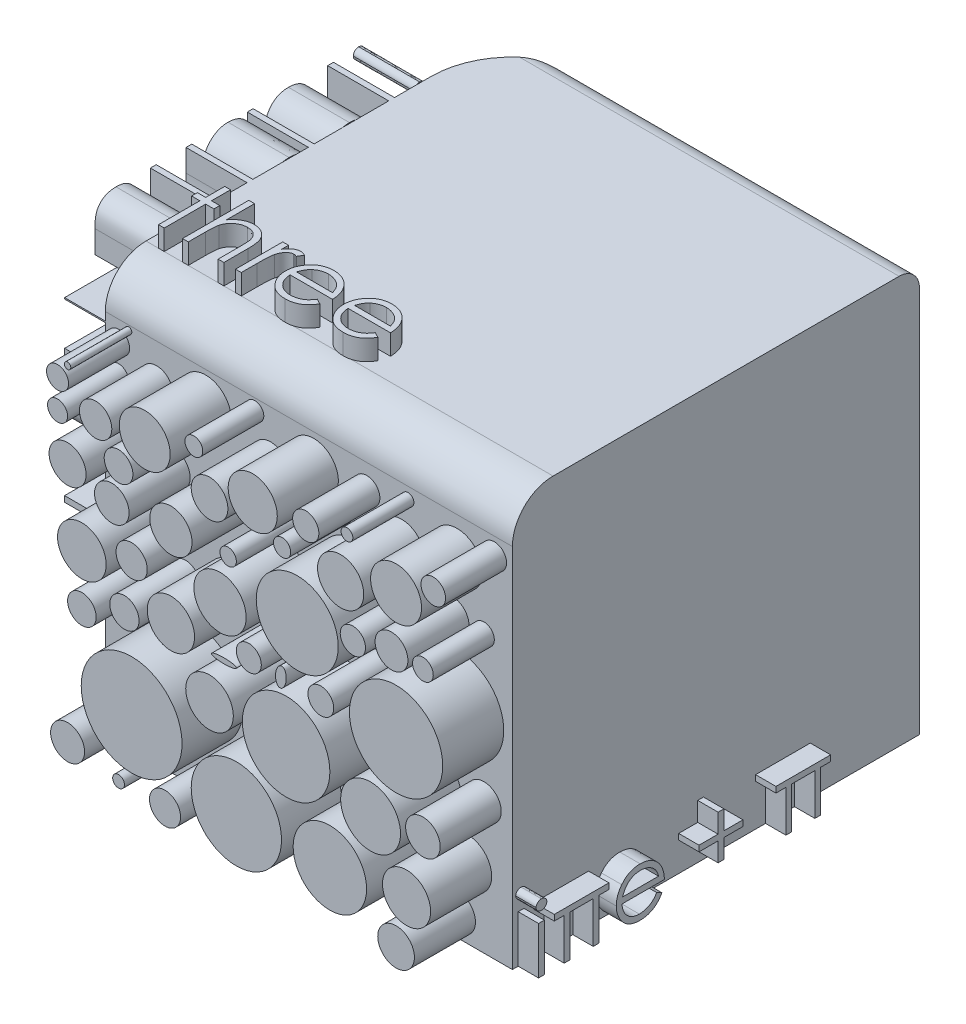
from build123d import *
from OCP.BRepFilletAPI import BRepFilletAPI_MakeFillet

# Parameters (mm, degrees)
SKETCH2_W           = 20
SKETCH2_H           = 20
BOSS_EXTRUDE1_DEPTH = 20
SKETCH3_W           = 0.284935898
SKETCH3_H           = 2.320192308
BOSS_EXTRUDE2_DEPTH = 1
FILLET1_R1          = 2
FILLET1_R2          = 1
FILLET1_R3          = 4
BOSS_EXTRUDE3_DEPTH = 1
SKETCH5_R           = 0.869274054
SKETCH5_R_2         = 1.87334708
SKETCH5_R_3         = 1.224259222
SKETCH5_R_4         = 0.854359486
SKETCH5_R_5         = 0.723058737
SKETCH5_R_6         = 0.828150602
SKETCH5_R_7         = 1.20534194
SKETCH5_R_8         = 2.196982283
SKETCH5_R_9         = 1.648859169
SKETCH5_R_10        = 0.887298728
SKETCH5_R_11        = 1.198491665
SKETCH5_R_12        = 1.240938395
SKETCH5_R_13        = 1.52286101
SKETCH5_R_14        = 2.08407997
SKETCH5_R_15        = 1.116428312
SKETCH5_R_16        = 0.510356374
SKETCH5_R_17        = 0.928303522
SKETCH5_R_18        = 1.048285303
SKETCH5_R_19        = 1.120954627
SKETCH5_R_20        = 1.035138007
SKETCH5_R_21        = 1.063032749
SKETCH5_R_22        = 0.901829478
SKETCH5_R_23        = 0.83084329
SKETCH5_R_24        = 0.806786337
SKETCH5_R_25        = 0.775997991
SKETCH5_R_26        = 0.848871038
SKETCH5_R_27        = 0.739481873
SKETCH5_R_28        = 1.066466648
SKETCH5_R_29        = 0.843889534
SKETCH5_R_30        = 0.704115082
SKETCH5_R_31        = 0.319725843
SKETCH5_R_32        = 0.681387214
SKETCH5_R_33        = 0.790534868
SKETCH5_R_34        = 0.573713006
SKETCH5_R_35        = 0.533233324
SKETCH5_R_36        = 0.625054899
SKETCH5_R_37        = 0.340042365
SKETCH5_R_38        = 0.519725647
SKETCH5_R_39        = 0.813729973
SKETCH5_R_40        = 0.720290961
SKETCH5_R_41        = 0.811333119
SKETCH5_R_42        = 0.907849135
SKETCH5_R_43        = 0.760866236
SKETCH5_R_44        = 0.443440105
SKETCH5_R_45        = 0.505502597
SKETCH5_R_46        = 0.653372918
SKETCH5_R_47        = 0.821463246
SKETCH5_R_48        = 0.243410693
SKETCH5_R_49        = 0.331818637
SKETCH5_R_50        = 0.58557289
SKETCH5_R_51        = 0.913548579
SKETCH5_R_52        = 0.618089992
SKETCH5_R_53        = 0.33645039
SKETCH5_R_54        = 0.353045631
SKETCH5_R_55        = 0.558214156
SKETCH5_R_56        = 0.708578995
SKETCH5_R_57        = 0.386937988
SKETCH5_R_58        = 0.620695254
SKETCH5_R_59        = 0.450911284
SKETCH5_R_60        = 0.446571325
SKETCH5_R_61        = 0.637073751
SKETCH5_R_62        = 0.354108624
SKETCH5_R_63        = 0.719749999
SKETCH5_RX          = 0.571418379
SKETCH5_RY          = 0.334928494
BOSS_EXTRUDE4_DEPTH = 4
SKETCH6_R           = 0.794272448
SKETCH6_R_2         = 0.85045789
SKETCH6_R_3         = 0.901030327
SKETCH6_R_4         = 1.16174239
SKETCH6_R_5         = 1.038098205
SKETCH6_R_6         = 2.014765062
SKETCH6_R_7         = 2.14961737
SKETCH6_R_8         = 2.477089822
SKETCH6_R_9         = 1.183351901
SKETCH6_R_10        = 2.217815956
SKETCH6_R_11        = 1.803840094
SKETCH6_R_12        = 1.195092222
SKETCH6_R_13        = 0.702366469
SKETCH6_R_14        = 1.252556633
SKETCH6_R_15        = 2.290309651
SKETCH6_R_16        = 1.471259211
SKETCH6_R_17        = 1.284780558
SKETCH6_R_18        = 1.169284811
SKETCH6_R_19        = 0.719100487
SKETCH6_R_20        = 0.910166483
SKETCH6_R_21        = 1.250904183
SKETCH6_R_22        = 0.643183028
SKETCH6_R_23        = 1.207146771
SKETCH6_R_24        = 1.133501294
SKETCH6_R_25        = 0.806547414
SKETCH6_R_26        = 0.403167986
SKETCH6_R_27        = 0.767115422
SKETCH6_R_28        = 0.492725753
SKETCH6_R_29        = 0.157493034
SKETCH6_R_30        = 0.541714877
SKETCH6_R_31        = 0.436948105
SKETCH6_R_32        = 0.614399725
SKETCH6_R_33        = 0.834280538
SKETCH6_R_34        = 0.764414303
SKETCH6_R_35        = 0.289432363
SKETCH6_R_36        = 0.90045624
SKETCH6_R_37        = 0.84902596
SKETCH6_R_38        = 0.633160864
SKETCH6_R_39        = 0.705305254
SKETCH6_R_40        = 0.508480831
SKETCH6_R_41        = 0.621454766
SKETCH6_R_42        = 0.603096786
SKETCH6_R_43        = 0.422088862
SKETCH6_RX          = 0.486141315
SKETCH6_RY          = 0.259275368
SKETCH6_RX_2        = 0.611023877
SKETCH6_RY_2        = 0.128636606
BOSS_EXTRUDE5_DEPTH = 3
SKETCH8_W           = 0.284935897
SKETCH8_H           = 3.256410256
BOSS_EXTRUDE6_DEPTH = 1
BOSS_EXTRUDE7_DEPTH = 3
BOSS_EXTRUDE8_DEPTH = 2


with BuildPart() as part:
    # Sketch2 → Boss-Extrude1 (new body)
    with BuildSketch(Plane(origin=(0, 0, 0), x_dir=(1, 0, 0), z_dir=(0, 1, 0))):
        with Locations((10, -10)):
            Rectangle(SKETCH2_W, SKETCH2_H)
    extrude(amount=BOSS_EXTRUDE1_DEPTH)

    # Sketch3 → Boss-Extrude2 (add)
    # profile 1 of 6: a face of its own
    with BuildSketch(Plane(origin=(20, 0, 0), x_dir=(0, 0, -1), z_dir=(1, 0, 0))):
        with BuildLine():
            add(Edge.make_bspline(
                [(-19.573868189, 3.297115385), (-19.556186781, 3.296295189), (-19.521563189, 3.294689089), (-19.47149501, 3.280935463), (-19.425904721, 3.257622177), (-19.385466349, 3.226344181), (-19.350766423, 3.189560043), (-19.326472493, 3.146687593), (-19.310858391, 3.100370114), (-19.308972844, 3.06806214), (-19.308012821, 3.05161258)],
                knots=[0, 0, 0, 0, 1.055194115, 2.066272739, 3.074728998, 4.095836921, 5.109056067, 6.073838105, 7.019297344, 8, 8, 8, 8], degree=3))
            add(Edge.make_bspline(
                [(-19.308012821, 3.05161258), (-19.308994494, 3.03559003), (-19.310935147, 3.003915346), (-19.326460432, 2.958400839), (-19.350973462, 2.916124096), (-19.385444098, 2.879411381), (-19.425910617, 2.848150675), (-19.471493444, 2.824832805), (-19.521563601, 2.811080395), (-19.55618692, 2.809474127), (-19.573868189, 2.808653846)],
                knots=[0, 0, 0, 0, 0.96129708, 1.900370562, 2.859976407, 3.87933698, 4.906634145, 5.921202961, 6.938410037, 8, 8, 8, 8], degree=3))
            add(Edge.make_bspline(
                [(-19.573868189, 2.808653846), (-19.591347267, 2.809442807), (-19.625368009, 2.810978415), (-19.674686502, 2.825102646), (-19.71988806, 2.848158655), (-19.760405299, 2.879206694), (-19.794178403, 2.916349565), (-19.818760455, 2.958375039), (-19.834249885, 3.003921915), (-19.836195369, 3.035592237), (-19.837179487, 3.05161258)],
                knots=[0, 0, 0, 0, 1.054934014, 2.053291228, 3.073705704, 4.106921865, 5.123545215, 6.088680038, 7.033164197, 8, 8, 8, 8], degree=3))
            add(Edge.make_bspline(
                [(-19.837179487, 3.05161258), (-19.83621693, 3.068059851), (-19.834326407, 3.100363328), (-19.818748845, 3.146713822), (-19.794383162, 3.189332756), (-19.760382936, 3.226548745), (-19.719894012, 3.257614247), (-19.674684964, 3.280665637), (-19.625368416, 3.294791066), (-19.591347405, 3.296326509), (-19.573868189, 3.297115385)],
                knots=[0, 0, 0, 0, 0.98631895, 1.937192651, 2.907499808, 3.917963147, 4.944918757, 5.95915025, 6.951458133, 8, 8, 8, 8], degree=3))
        make_face()
    # profile 2 of 6: a face of its own
    with BuildSketch(Plane(origin=(20, 0, 0), x_dir=(0, 0, -1), z_dir=(1, 0, 0))):
        with Locations((-19.572596154, 1.160096154)):
            Rectangle(SKETCH3_W, SKETCH3_H)
    # profile 3 of 6: a face of its own
    with BuildSketch(Plane(origin=(20, 0, 0), x_dir=(0, 0, -1), z_dir=(1, 0, 0))):
        Polygon((-16.256585145, 2.03525641), (-16.745046683, 2.03525641), (-16.745046683, 0), (-17.029982581, 0), (-17.029982581, 2.03525641), (-18.169726171, 2.03525641), (-18.169726171, 0), (-18.454662068, 0), (-18.454662068, 2.03525641), (-18.943123606, 2.03525641), (-18.943123606, 2.320192308), (-16.256585145, 2.320192308), align=None)
    # profile 4 of 6: a face of its own
    with BuildSketch(Plane(origin=(20, 0, 0), x_dir=(0, 0, -1), z_dir=(1, 0, 0))):
        with BuildLine():
            Line((-13.909152811, 0.732692308), (-13.656017795, 0.599764623))
            add(Edge.make_bspline(
                [(-13.656017795, 0.599764623), (-13.676189563, 0.563983887), (-13.715435837, 0.494368744), (-13.782927944, 0.398726985), (-13.853677895, 0.312686557), (-13.930879352, 0.238546085), (-14.012222561, 0.1739109), (-14.098158612, 0.117361587), (-14.189134897, 0.069175501), (-14.285155718, 0.028578565), (-14.387027454, -0.002635762), (-14.494996972, -0.024683162), (-14.609271115, -0.038311413), (-14.687599435, -0.039894505), (-14.727707498, -0.040705128)],
                knots=[0, 0, 0, 0, 1.120438281, 2.179929193, 3.190490725, 4.156257408, 5.095198341, 6.022838206, 6.959905092, 7.901321166, 8.864066838, 9.862729781, 10.905609505, 12, 12, 12, 12], degree=3))
            add(Edge.make_bspline(
                [(-14.727707498, -0.040705128), (-14.772286292, -0.039664476), (-14.859246605, -0.037634466), (-14.985829089, -0.020133445), (-15.10500899, 0.008416481), (-15.216779607, 0.048299508), (-15.320867222, 0.100394295), (-15.417478712, 0.163857539), (-15.507122139, 0.238363227), (-15.586972671, 0.324556715), (-15.658858193, 0.416796776), (-15.722290902, 0.5129139), (-15.775320143, 0.612666254), (-15.818457153, 0.7154188), (-15.853295852, 0.820523904), (-15.877577076, 0.928937878), (-15.891574062, 1.040367301), (-15.893718952, 1.115748455), (-15.894799846, 1.153735978)],
                knots=[0, 0, 0, 0, 1.145258523, 2.234067595, 3.276747158, 4.290159414, 5.277019952, 6.260822364, 7.254936242, 8.264827045, 9.274100331, 10.257902744, 11.220704747, 12.172965371, 13.118907548, 14.062713208, 15.023725156, 16, 16, 16, 16], degree=3))
            add(Edge.make_bspline(
                [(-15.894799846, 1.153735978), (-15.893839054, 1.189382002), (-15.89193489, 1.260027716), (-15.879932675, 1.364590031), (-15.858661724, 1.466215842), (-15.829473201, 1.564989591), (-15.791780285, 1.660745898), (-15.745668201, 1.753543042), (-15.691065115, 1.843282276), (-15.648907761, 1.899890833), (-15.627672442, 1.928405449)],
                knots=[0, 0, 0, 0, 1.024358464, 2.0301432, 3.019427413, 4.004406732, 4.986367066, 5.972626655, 6.978780325, 8, 8, 8, 8], degree=3))
            add(Edge.make_bspline(
                [(-15.627672442, 1.928405449), (-15.598909044, 1.962757924), (-15.5422934, 2.030374674), (-15.446538706, 2.119218727), (-15.342852099, 2.193644152), (-15.232532981, 2.25533634), (-15.11429918, 2.302211719), (-14.989740037, 2.337143598), (-14.857437256, 2.356717936), (-14.766990377, 2.359482757), (-14.720711304, 2.360897436)],
                knots=[0, 0, 0, 0, 1.030682036, 2.02871468, 2.997146059, 3.962720338, 4.930598197, 5.918074684, 6.934738563, 8, 8, 8, 8], degree=3))
            add(Edge.make_bspline(
                [(-14.720711304, 2.360897436), (-14.673133834, 2.35966912), (-14.579797682, 2.357259445), (-14.443697115, 2.334919842), (-14.314918465, 2.299493596), (-14.193513265, 2.249461229), (-14.079469206, 2.18490935), (-13.973527575, 2.104952108), (-13.87387656, 2.012044272), (-13.815902349, 1.940594789), (-13.786401409, 1.904236779)],
                knots=[0, 0, 0, 0, 1.056321875, 2.072262726, 3.055038591, 4.01806755, 4.982017516, 5.957941055, 6.960871419, 8, 8, 8, 8], degree=3))
            add(Edge.make_bspline(
                [(-13.786401409, 1.904236779), (-13.766329115, 1.876837816), (-13.726318134, 1.822222265), (-13.676201121, 1.733167001), (-13.632696913, 1.639993819), (-13.597923441, 1.541196621), (-13.56976618, 1.437946002), (-13.549394637, 1.329503836), (-13.537447911, 1.215902417), (-13.535099593, 1.138499042), (-13.53390241, 1.099038462)],
                knots=[0, 0, 0, 0, 0.94817472, 1.890038105, 2.849395472, 3.817997239, 4.812318967, 5.836947057, 6.897266129, 8, 8, 8, 8], degree=3))
            Line((-13.53390241, 1.099038462), (-15.609863949, 1.099038462))
            add(Edge.make_bspline(
                [(-15.609863949, 1.099038462), (-15.608467306, 1.068467326), (-15.605720864, 1.008350421), (-15.592916412, 0.920384068), (-15.572733596, 0.836588251), (-15.544368089, 0.757591491), (-15.510017451, 0.682362018), (-15.467938979, 0.611457885), (-15.417738098, 0.545202048), (-15.361744071, 0.483001859), (-15.29941692, 0.427611026), (-15.233846142, 0.378034057), (-15.164092694, 0.336481837), (-15.090706576, 0.302754366), (-15.013806456, 0.276350779), (-14.933368108, 0.258327828), (-14.849549816, 0.246256381), (-14.792412758, 0.244914113), (-14.763324485, 0.244230769)],
                knots=[0, 0, 0, 0, 1.094153842, 2.151609401, 3.174256925, 4.172055639, 5.149267565, 6.128595816, 7.11444997, 8.118368179, 9.117203808, 10.09244225, 11.054858984, 12.015122123, 12.976791628, 13.957293641, 14.960065497, 16, 16, 16, 16], degree=3))
            add(Edge.make_bspline(
                [(-14.763324485, 0.244230769), (-14.734884516, 0.244782363), (-14.678454161, 0.245876832), (-14.594415669, 0.256519351), (-14.511739097, 0.273728102), (-14.430766634, 0.297214021), (-14.353141652, 0.325858737), (-14.281254617, 0.360423472), (-14.21514185, 0.398659314), (-14.153350031, 0.442392376), (-14.093414201, 0.495921231), (-14.033957803, 0.56271935), (-13.970206839, 0.641720179), (-13.930301994, 0.701179461), (-13.909152811, 0.732692308)],
                knots=[0, 0, 0, 0, 0.99110716, 1.966546729, 2.947904876, 3.932708344, 4.903319531, 5.828989031, 6.710028674, 7.56322171, 8.463672341, 9.504779593, 10.677557249, 12, 12, 12, 12], degree=3))
        make_face()
        with BuildLine():
            add(Edge.make_bspline(
                [(-13.818838308, 1.383974359), (-13.829267388, 1.421768537), (-13.849340012, 1.494510165), (-13.891283, 1.595240115), (-13.938519326, 1.68476414), (-13.994419039, 1.762397092), (-14.057754598, 1.831343136), (-14.130911299, 1.891594282), (-14.212949574, 1.945494398), (-14.303445366, 1.990989879), (-14.399277556, 2.02971568), (-14.499613173, 2.055682749), (-14.60199131, 2.073471405), (-14.671237412, 2.075127947), (-14.706082899, 2.075961538)],
                knots=[0, 0, 0, 0, 1.154881502, 2.222775134, 3.210006277, 4.132804581, 5.035138423, 5.962687519, 6.919655026, 7.923214229, 8.944639381, 9.960483929, 10.97369054, 12, 12, 12, 12], degree=3))
            add(Edge.make_bspline(
                [(-14.706082899, 2.075961538), (-14.734521318, 2.075406665), (-14.790738094, 2.074309797), (-14.873561206, 2.063904751), (-14.953099219, 2.046705463), (-15.029939015, 2.023151538), (-15.10307366, 1.991756592), (-15.174007485, 1.954941807), (-15.240936845, 1.910000514), (-15.282793592, 1.875747838), (-15.303939469, 1.85844351)],
                knots=[0, 0, 0, 0, 1.04873581, 2.073130211, 3.073294108, 4.04793562, 5.032784715, 6.005352987, 6.992311501, 8, 8, 8, 8], degree=3))
            add(Edge.make_bspline(
                [(-15.303939469, 1.85844351), (-15.319082661, 1.844750809), (-15.34972879, 1.81704012), (-15.390677691, 1.769297911), (-15.429884835, 1.717816137), (-15.465566077, 1.660625203), (-15.498293602, 1.598376353), (-15.528918724, 1.531594641), (-15.55648354, 1.459773302), (-15.571992154, 1.409724017), (-15.57997112, 1.383974359)],
                knots=[0, 0, 0, 0, 0.879870761, 1.780643979, 2.707998968, 3.669668524, 4.684282772, 5.740141944, 6.837334558, 8, 8, 8, 8], degree=3))
            Line((-15.57997112, 1.383974359), (-13.818838308, 1.383974359))
        make_face(mode=Mode.SUBTRACT)
    # profile 5 of 6: a face of its own
    with BuildSketch(Plane(origin=(20, 0, 0), x_dir=(0, 0, -1), z_dir=(1, 0, 0))):
        Polygon((-10.894403598, 1.709615385), (-10.894403598, 2.645833333), (-10.6094677, 2.645833333), (-10.6094677, 1.709615385), (-9.673249751, 1.709615385), (-9.673249751, 1.424679487), (-10.6094677, 1.424679487), (-10.6094677, 0.488461538), (-10.894403598, 0.488461538), (-10.894403598, 1.424679487), (-11.830621546, 1.424679487), (-11.830621546, 1.709615385), align=None)
    # profile 6 of 6: a face of its own
    with BuildSketch(Plane(origin=(20, 0, 0), x_dir=(0, 0, -1), z_dir=(1, 0, 0))):
        Polygon((-5.364587302, 2.03525641), (-5.85304884, 2.03525641), (-5.85304884, 0), (-6.137984738, 0), (-6.137984738, 2.03525641), (-7.277728327, 2.03525641), (-7.277728327, 0), (-7.562664225, 0), (-7.562664225, 2.03525641), (-8.051125763, 2.03525641), (-8.051125763, 2.320192308), (-5.364587302, 2.320192308), align=None)
    extrude(amount=BOSS_EXTRUDE2_DEPTH)

    # Fillet1: one fillet with a radius per group of edges: ONE call of the kernel's fillet builder (fillet() takes one radius for all edges)
    fillet1_edges_1 = [part.edges().sort_by_distance(p)[0] for p in [
        (10, 20, 20),
    ]]
    fillet1_edges_2 = [part.edges().sort_by_distance(p)[0] for p in [
        (10, 20, 0),
    ]]
    fillet1_edges_3 = [part.edges().sort_by_distance(p)[0] for p in [
        (0, 10, 0),
    ]]
    fillet1 = BRepFilletAPI_MakeFillet(part.part.solid().wrapped)
    for e in fillet1_edges_1:
        fillet1.Add(FILLET1_R1, e.wrapped)
    for e in fillet1_edges_2:
        fillet1.Add(FILLET1_R2, e.wrapped)
    for e in fillet1_edges_3:
        fillet1.Add(FILLET1_R3, e.wrapped)
    add(Compound.cast(fillet1.Shape()), mode=Mode.REPLACE)

    # Sketch4 → Boss-Extrude3 (add)
    # profile 1 of 5: a face of its own
    with BuildSketch(Plane(origin=(0, 20, 0), x_dir=(1, 0, 0), z_dir=(0, 1, 0))):
        Polygon((0.610576923, -14.743589744), (0.895512821, -14.743589744), (0.895512821, -15.679807692), (1.302564103, -15.679807692), (1.302564103, -15.96474359), (0.895512821, -15.96474359), (0.895512821, -18), (0.610576923, -18), (0.610576923, -15.96474359), (0.203525641, -15.96474359), (0.203525641, -15.679807692), (0.610576923, -15.679807692), align=None)
    # profile 2 of 5: a face of its own
    with BuildSketch(Plane(origin=(0, 20, 0), x_dir=(1, 0, 0), z_dir=(0, 1, 0))):
        with BuildLine():
            Line((1.791025641, -14.743589744), (2.075961538, -14.743589744))
            Line((2.075961538, -14.743589744), (2.075961538, -16.118023838))
            add(Edge.make_bspline(
                [(2.075961538, -16.118023838), (2.106547948, -16.079793226), (2.166101254, -16.005356265), (2.266337017, -15.90823647), (2.369271308, -15.824054864), (2.478459386, -15.757043806), (2.591898072, -15.704106085), (2.710065807, -15.666561577), (2.832984545, -15.643473796), (2.916464502, -15.640572374), (2.958754006, -15.639102564)],
                knots=[0, 0, 0, 0, 1.125788106, 2.19196713, 3.20547328, 4.180437432, 5.132270164, 6.079753143, 7.027236121, 8, 8, 8, 8], degree=3))
            add(Edge.make_bspline(
                [(2.958754006, -15.639102564), (3.001689434, -15.640685919), (3.085724423, -15.643784926), (3.208081178, -15.668289921), (3.322345686, -15.710161311), (3.428178272, -15.767462827), (3.523269248, -15.83883032), (3.607497248, -15.921227487), (3.676295687, -16.01672597), (3.723103457, -16.104951286), (3.753559334, -16.183454299), (3.772837777, -16.250797421), (3.789183764, -16.325838013), (3.803425667, -16.408537449), (3.81291763, -16.499292712), (3.82054182, -16.597694357), (3.825963317, -16.703736743), (3.826173416, -16.777142969), (3.826282051, -16.815099159)],
                knots=[0, 0, 0, 0, 1.235656852, 2.418478516, 3.575258207, 4.727955599, 5.870717718, 6.98870536, 8.107142894, 9.245821548, 9.854588956, 10.528768408, 11.260415777, 12.065282286, 12.943670737, 13.886611085, 14.907229059, 16, 16, 16, 16], degree=3))
            Line((3.826282051, -16.815099159), (3.826282051, -18))
            Line((3.826282051, -18), (3.541346154, -18))
            Line((3.541346154, -18), (3.541346154, -16.90859375))
            add(Edge.make_bspline(
                [(3.541346154, -16.90859375), (3.541173522, -16.877004614), (3.540843306, -16.816579973), (3.5397517, -16.730069289), (3.537314919, -16.651604938), (3.53337717, -16.581438389), (3.529235784, -16.519471821), (3.523535918, -16.465795221), (3.516904491, -16.420334868), (3.510945668, -16.392971241), (3.508273237, -16.380699119)],
                knots=[0, 0, 0, 0, 1.430932559, 2.737130458, 3.918967929, 4.986496826, 5.920444988, 6.731744033, 7.431208747, 8, 8, 8, 8], degree=3))
            add(Edge.make_bspline(
                [(3.508273237, -16.380699119), (3.497909815, -16.344690751), (3.477986196, -16.275464874), (3.431678388, -16.181428259), (3.373839856, -16.101250672), (3.303221269, -16.03601414), (3.221071896, -15.984840815), (3.126856071, -15.949400755), (3.021460524, -15.927404607), (2.947209546, -15.925191811), (2.908508614, -15.924038462)],
                knots=[0, 0, 0, 0, 1.090059168, 2.095632401, 3.037101401, 3.955032261, 4.878929692, 5.839099886, 6.873700383, 8, 8, 8, 8], degree=3))
            add(Edge.make_bspline(
                [(2.908508614, -15.924038462), (2.885587134, -15.924470104), (2.840226117, -15.925324313), (2.772962685, -15.93390035), (2.707712748, -15.947914544), (2.643847916, -15.966877947), (2.582721729, -15.992682113), (2.522552463, -16.022554499), (2.465044859, -16.059119844), (2.409177725, -16.100146076), (2.357182534, -16.145566501), (2.308807222, -16.193506239), (2.265683157, -16.244555671), (2.226613792, -16.297895776), (2.192887776, -16.354258189), (2.163448194, -16.413099392), (2.138469384, -16.474496767), (2.126057227, -16.517109858), (2.119846755, -16.53843149)],
                knots=[0, 0, 0, 0, 1.024319606, 2.027102035, 3.025350316, 4.005802111, 5.00026367, 5.987881639, 7.005602596, 8.042517216, 9.083927026, 10.089214625, 11.084353441, 12.06828073, 13.041928858, 14.016821737, 15.00770877, 16, 16, 16, 16], degree=3))
            add(Edge.make_bspline(
                [(2.119846755, -16.53843149), (2.116273132, -16.553871924), (2.108485767, -16.587518531), (2.100035882, -16.643012382), (2.092472309, -16.707497876), (2.086078268, -16.780877207), (2.082156611, -16.863419262), (2.077930921, -16.954560775), (2.076357923, -17.054872651), (2.076097615, -17.124627861), (2.075961538, -17.161092748)],
                knots=[0, 0, 0, 0, 0.607992626, 1.324890765, 2.152360218, 3.099583803, 4.150613268, 5.323148443, 6.60066238, 8, 8, 8, 8], degree=3))
            Line((2.075961538, -17.161092748), (2.075961538, -18))
            Line((2.075961538, -18), (1.791025641, -18))
            Line((1.791025641, -18), (1.791025641, -14.743589744))
        make_face()
    # profile 3 of 5: a face of its own
    with BuildSketch(Plane(origin=(0, 20, 0), x_dir=(1, 0, 0), z_dir=(0, 1, 0))):
        with BuildLine():
            Line((4.396153846, -15.679807692), (4.681089744, -15.679807692))
            Line((4.681089744, -15.679807692), (4.681089744, -16.021349159))
            add(Edge.make_bspline(
                [(4.681089744, -16.021349159), (4.70212526, -15.989548514), (4.742355523, -15.928730029), (4.80922368, -15.848294306), (4.877715988, -15.781696371), (4.948160337, -15.728625322), (5.021074756, -15.688880564), (5.09485899, -15.659767597), (5.170673881, -15.642552461), (5.221620769, -15.64025407), (5.247145433, -15.639102564)],
                knots=[0, 0, 0, 0, 1.2804753, 2.448899062, 3.506932113, 4.484331642, 5.4025378, 6.288909075, 7.142734305, 8, 8, 8, 8], degree=3))
            add(Edge.make_bspline(
                [(5.247145433, -15.639102564), (5.266945029, -15.640182542), (5.307683985, -15.642404666), (5.369353905, -15.658017343), (5.432893323, -15.682943835), (5.473843917, -15.706384608), (5.495192308, -15.718604768)],
                knots=[0, 0, 0, 0, 0.901110191, 1.854092781, 2.881294221, 4, 4, 4, 4], degree=3))
            Line((5.495192308, -15.718604768), (5.338731971, -15.965379607))
            add(Edge.make_bspline(
                [(5.338731971, -15.965379607), (5.325025931, -15.959265223), (5.299009242, -15.947658951), (5.260950457, -15.933922985), (5.225860958, -15.925834976), (5.20350573, -15.924609682), (5.193083934, -15.924038462)],
                knots=[0, 0, 0, 0, 1.180555205, 2.24091978, 3.179933427, 4, 4, 4, 4], degree=3))
            add(Edge.make_bspline(
                [(5.193083934, -15.924038462), (5.170218733, -15.925562495), (5.123580351, -15.928671083), (5.055105126, -15.95310843), (4.988659447, -15.992592041), (4.935889439, -16.036380835), (4.895029681, -16.078606337), (4.865873905, -16.115480245), (4.839128842, -16.156826575), (4.813574428, -16.201938502), (4.790291432, -16.251586291), (4.768561125, -16.305273921), (4.748913442, -16.363063573), (4.737710006, -16.403324859), (4.731971154, -16.423948317)],
                knots=[0, 0, 0, 0, 1.125678352, 2.296057538, 3.5422874, 4.923748041, 5.663163013, 6.437101912, 7.23742474, 8.08941207, 8.991984279, 9.93940061, 10.944477711, 12, 12, 12, 12], degree=3))
            add(Edge.make_bspline(
                [(4.731971154, -16.423948317), (4.727678197, -16.44234261), (4.718169624, -16.483084572), (4.708924443, -16.551436448), (4.699789952, -16.632193624), (4.693352305, -16.725580891), (4.687385081, -16.831365036), (4.684019507, -16.949707215), (4.681204515, -17.080728898), (4.681129161, -17.172327062), (4.681089744, -17.220242388)],
                knots=[0, 0, 0, 0, 0.566838948, 1.255505196, 2.06880316, 3.007127437, 4.065329342, 5.249902469, 6.561414163, 8, 8, 8, 8], degree=3))
            Line((4.681089744, -17.220242388), (4.681089744, -18))
            Line((4.681089744, -18), (4.396153846, -18))
            Line((4.396153846, -18), (4.396153846, -15.679807692))
        make_face()
    # profile 4 of 5: a face of its own
    with BuildSketch(Plane(origin=(0, 20, 0), x_dir=(1, 0, 0), z_dir=(0, 1, 0))):
        with BuildLine():
            Line((7.684364984, -17.267307692), (7.9375, -17.400235377))
            add(Edge.make_bspline(
                [(7.9375, -17.400235377), (7.917328231, -17.436016113), (7.878081958, -17.505631256), (7.810589851, -17.601273015), (7.739839899, -17.687313443), (7.662638443, -17.761453915), (7.581295234, -17.8260891), (7.495359183, -17.882638413), (7.404382898, -17.930824499), (7.308362076, -17.971421435), (7.206490341, -18.002635762), (7.098520822, -18.024683162), (6.98424668, -18.038311413), (6.90591836, -18.039894505), (6.865810296, -18.040705128)],
                knots=[0, 0, 0, 0, 1.120438281, 2.179929193, 3.190490725, 4.156257408, 5.095198341, 6.022838206, 6.959905092, 7.901321166, 8.864066838, 9.862729781, 10.905609505, 12, 12, 12, 12], degree=3))
            add(Edge.make_bspline(
                [(6.865810296, -18.040705128), (6.821231503, -18.039664476), (6.73427119, -18.037634466), (6.607688705, -18.020133445), (6.488508804, -17.991583519), (6.376738188, -17.951700492), (6.272650573, -17.899605705), (6.176039083, -17.836142461), (6.086395656, -17.761636773), (6.006545124, -17.675443285), (5.934659601, -17.583203224), (5.871226893, -17.4870861), (5.818197652, -17.387333746), (5.775060642, -17.2845812), (5.740221943, -17.179476096), (5.715940718, -17.071062122), (5.701943733, -16.959632699), (5.699798843, -16.884251545), (5.698717949, -16.846264022)],
                knots=[0, 0, 0, 0, 1.145258523, 2.234067595, 3.276747158, 4.290159414, 5.277019952, 6.260822364, 7.254936242, 8.264827045, 9.274100331, 10.257902744, 11.220704747, 12.172965371, 13.118907548, 14.062713208, 15.023725156, 16, 16, 16, 16], degree=3))
            add(Edge.make_bspline(
                [(5.698717949, -16.846264022), (5.699678741, -16.810617998), (5.701582905, -16.739972284), (5.713585119, -16.635409969), (5.734856071, -16.533784158), (5.764044593, -16.435010409), (5.80173751, -16.339254102), (5.847849594, -16.246456958), (5.90245268, -16.156717724), (5.944610034, -16.100109167), (5.965845353, -16.071594551)],
                knots=[0, 0, 0, 0, 1.024358464, 2.0301432, 3.019427413, 4.004406732, 4.986367066, 5.972626655, 6.978780325, 8, 8, 8, 8], degree=3))
            add(Edge.make_bspline(
                [(5.965845353, -16.071594551), (5.994608751, -16.037242076), (6.051224395, -15.969625326), (6.146979089, -15.880781273), (6.250665695, -15.806355848), (6.360984813, -15.74466366), (6.479218615, -15.697788281), (6.603777757, -15.662856402), (6.736080539, -15.643282064), (6.826527418, -15.640517243), (6.87280649, -15.639102564)],
                knots=[0, 0, 0, 0, 1.030682036, 2.02871468, 2.997146059, 3.962720338, 4.930598197, 5.918074684, 6.934738563, 8, 8, 8, 8], degree=3))
            add(Edge.make_bspline(
                [(6.87280649, -15.639102564), (6.920383961, -15.64033088), (7.013720113, -15.642740555), (7.14982068, -15.665080158), (7.27859933, -15.700506404), (7.40000453, -15.750538771), (7.514048589, -15.81509065), (7.61999022, -15.895047892), (7.719641235, -15.987955728), (7.777615446, -16.059405211), (7.807116386, -16.095763221)],
                knots=[0, 0, 0, 0, 1.056321875, 2.072262726, 3.055038591, 4.01806755, 4.982017516, 5.957941055, 6.960871419, 8, 8, 8, 8], degree=3))
            add(Edge.make_bspline(
                [(7.807116386, -16.095763221), (7.82718868, -16.123162184), (7.867199661, -16.177777735), (7.917316673, -16.266832999), (7.960820882, -16.360006181), (7.995594353, -16.458803379), (8.023751615, -16.562053998), (8.044123158, -16.670496164), (8.056069883, -16.784097583), (8.058418202, -16.861500958), (8.059615385, -16.900961538)],
                knots=[0, 0, 0, 0, 0.94817472, 1.890038105, 2.849395472, 3.817997239, 4.812318967, 5.836947057, 6.897266129, 8, 8, 8, 8], degree=3))
            Line((8.059615385, -16.900961538), (5.983653846, -16.900961538))
            add(Edge.make_bspline(
                [(5.983653846, -16.900961538), (5.985050489, -16.931532674), (5.987796931, -16.991649579), (6.000601383, -17.079615932), (6.020784199, -17.163411749), (6.049149706, -17.242408509), (6.083500344, -17.317637982), (6.125578815, -17.388542115), (6.175779696, -17.454797952), (6.231773724, -17.516998141), (6.294100875, -17.572388974), (6.359671652, -17.621965943), (6.429425101, -17.663518163), (6.502811219, -17.697245634), (6.579711339, -17.723649221), (6.660149687, -17.741672172), (6.743967978, -17.753743619), (6.801105037, -17.755085887), (6.830193309, -17.755769231)],
                knots=[0, 0, 0, 0, 1.094153842, 2.151609401, 3.174256925, 4.172055639, 5.149267565, 6.128595816, 7.11444997, 8.118368179, 9.117203808, 10.09244225, 11.054858984, 12.015122123, 12.976791628, 13.957293641, 14.960065497, 16, 16, 16, 16], degree=3))
            add(Edge.make_bspline(
                [(6.830193309, -17.755769231), (6.858633279, -17.755217637), (6.915063634, -17.754123168), (6.999102126, -17.743480649), (7.081778698, -17.726271898), (7.162751161, -17.702785979), (7.240376143, -17.674141263), (7.312263177, -17.639576528), (7.378375944, -17.601340686), (7.440167764, -17.557607624), (7.500103594, -17.504078769), (7.559559992, -17.43728065), (7.623310956, -17.358279821), (7.663215801, -17.298820539), (7.684364984, -17.267307692)],
                knots=[0, 0, 0, 0, 0.99110716, 1.966546729, 2.947904876, 3.932708344, 4.903319531, 5.828989031, 6.710028674, 7.56322171, 8.463672341, 9.504779593, 10.677557249, 12, 12, 12, 12], degree=3))
        make_face()
        with BuildLine():
            add(Edge.make_bspline(
                [(7.774679487, -16.616025641), (7.764250406, -16.578231463), (7.744177783, -16.505489835), (7.702234795, -16.404759885), (7.654998469, -16.31523586), (7.599098755, -16.237602908), (7.535763197, -16.168656864), (7.462606496, -16.108405718), (7.380568221, -16.054505602), (7.290072429, -16.009010121), (7.194240238, -15.97028432), (7.093904621, -15.944317251), (6.991526485, -15.926528595), (6.922280383, -15.924872053), (6.887434896, -15.924038462)],
                knots=[0, 0, 0, 0, 1.154881502, 2.222775134, 3.210006277, 4.132804581, 5.035138423, 5.962687519, 6.919655026, 7.923214229, 8.944639381, 9.960483929, 10.97369054, 12, 12, 12, 12], degree=3))
            add(Edge.make_bspline(
                [(6.887434896, -15.924038462), (6.858996477, -15.924593335), (6.802779701, -15.925690203), (6.719956589, -15.936095249), (6.640418576, -15.953294537), (6.56357878, -15.976848462), (6.490444135, -16.008243408), (6.419510309, -16.045058193), (6.35258095, -16.089999486), (6.310724203, -16.124252162), (6.289578325, -16.14155649)],
                knots=[0, 0, 0, 0, 1.04873581, 2.073130211, 3.073294108, 4.04793562, 5.032784715, 6.005352987, 6.992311501, 8, 8, 8, 8], degree=3))
            add(Edge.make_bspline(
                [(6.289578325, -16.14155649), (6.274435134, -16.155249191), (6.243789005, -16.18295988), (6.202840103, -16.230702089), (6.16363296, -16.282183863), (6.127951718, -16.339374797), (6.095224193, -16.401623647), (6.064599071, -16.468405359), (6.037034254, -16.540226698), (6.02152564, -16.590275983), (6.013546675, -16.616025641)],
                knots=[0, 0, 0, 0, 0.879870761, 1.780643979, 2.707998968, 3.669668524, 4.684282772, 5.740141944, 6.837334558, 8, 8, 8, 8], degree=3))
            Line((6.013546675, -16.616025641), (7.774679487, -16.616025641))
        make_face(mode=Mode.SUBTRACT)
    # profile 5 of 5: a face of its own
    with BuildSketch(Plane(origin=(0, 20, 0), x_dir=(1, 0, 0), z_dir=(0, 1, 0))):
        with BuildLine():
            Line((10.533723958, -17.267307692), (10.786858974, -17.400235377))
            add(Edge.make_bspline(
                [(10.786858974, -17.400235377), (10.766687206, -17.436016113), (10.727440932, -17.505631256), (10.659948825, -17.601273015), (10.589198874, -17.687313443), (10.511997417, -17.761453915), (10.430654208, -17.8260891), (10.344718157, -17.882638413), (10.253741873, -17.930824499), (10.157721051, -17.971421435), (10.055849315, -18.002635762), (9.947879797, -18.024683162), (9.833605654, -18.038311413), (9.755277334, -18.039894505), (9.715169271, -18.040705128)],
                knots=[0, 0, 0, 0, 1.120438281, 2.179929193, 3.190490725, 4.156257408, 5.095198341, 6.022838206, 6.959905092, 7.901321166, 8.864066838, 9.862729781, 10.905609505, 12, 12, 12, 12], degree=3))
            add(Edge.make_bspline(
                [(9.715169271, -18.040705128), (9.670590477, -18.039664476), (9.583630165, -18.037634466), (9.45704768, -18.020133445), (9.337867779, -17.991583519), (9.226097162, -17.951700492), (9.122009547, -17.899605705), (9.025398058, -17.836142461), (8.93575463, -17.761636773), (8.855904098, -17.675443285), (8.784018576, -17.583203224), (8.720585868, -17.4870861), (8.667556627, -17.387333746), (8.624419616, -17.2845812), (8.589580917, -17.179476096), (8.565299693, -17.071062122), (8.551302707, -16.959632699), (8.549157817, -16.884251545), (8.548076923, -16.846264022)],
                knots=[0, 0, 0, 0, 1.145258523, 2.234067595, 3.276747158, 4.290159414, 5.277019952, 6.260822364, 7.254936242, 8.264827045, 9.274100331, 10.257902744, 11.220704747, 12.172965371, 13.118907548, 14.062713208, 15.023725156, 16, 16, 16, 16], degree=3))
            add(Edge.make_bspline(
                [(8.548076923, -16.846264022), (8.549037716, -16.810617998), (8.550941879, -16.739972284), (8.562944094, -16.635409969), (8.584215045, -16.533784158), (8.613403568, -16.435010409), (8.651096484, -16.339254102), (8.697208568, -16.246456958), (8.751811654, -16.156717724), (8.793969008, -16.100109167), (8.815204327, -16.071594551)],
                knots=[0, 0, 0, 0, 1.024358464, 2.0301432, 3.019427413, 4.004406732, 4.986367066, 5.972626655, 6.978780325, 8, 8, 8, 8], degree=3))
            add(Edge.make_bspline(
                [(8.815204327, -16.071594551), (8.843967725, -16.037242076), (8.900583369, -15.969625326), (8.996338063, -15.880781273), (9.10002467, -15.806355848), (9.210343788, -15.74466366), (9.328577589, -15.697788281), (9.453136732, -15.662856402), (9.585439514, -15.643282064), (9.675886392, -15.640517243), (9.722165465, -15.639102564)],
                knots=[0, 0, 0, 0, 1.030682036, 2.02871468, 2.997146059, 3.962720338, 4.930598197, 5.918074684, 6.934738563, 8, 8, 8, 8], degree=3))
            add(Edge.make_bspline(
                [(9.722165465, -15.639102564), (9.769742935, -15.64033088), (9.863079087, -15.642740555), (9.999179654, -15.665080158), (10.127958304, -15.700506404), (10.249363504, -15.750538771), (10.363407564, -15.81509065), (10.469349194, -15.895047892), (10.569000209, -15.987955728), (10.62697442, -16.059405211), (10.656475361, -16.095763221)],
                knots=[0, 0, 0, 0, 1.056321875, 2.072262726, 3.055038591, 4.01806755, 4.982017516, 5.957941055, 6.960871419, 8, 8, 8, 8], degree=3))
            add(Edge.make_bspline(
                [(10.656475361, -16.095763221), (10.676547655, -16.123162184), (10.716558635, -16.177777735), (10.766675648, -16.266832999), (10.810179856, -16.360006181), (10.844953328, -16.458803379), (10.87311059, -16.562053998), (10.893482132, -16.670496164), (10.905428858, -16.784097583), (10.907777176, -16.861500958), (10.908974359, -16.900961538)],
                knots=[0, 0, 0, 0, 0.94817472, 1.890038105, 2.849395472, 3.817997239, 4.812318967, 5.836947057, 6.897266129, 8, 8, 8, 8], degree=3))
            Line((10.908974359, -16.900961538), (8.833012821, -16.900961538))
            add(Edge.make_bspline(
                [(8.833012821, -16.900961538), (8.834409463, -16.931532674), (8.837155906, -16.991649579), (8.849960357, -17.079615932), (8.870143173, -17.163411749), (8.89850868, -17.242408509), (8.932859318, -17.317637982), (8.97493779, -17.388542115), (9.025138671, -17.454797952), (9.081132698, -17.516998141), (9.143459849, -17.572388974), (9.209030627, -17.621965943), (9.278784075, -17.663518163), (9.352170194, -17.697245634), (9.429070313, -17.723649221), (9.509508661, -17.741672172), (9.593326953, -17.753743619), (9.650464011, -17.755085887), (9.679552284, -17.755769231)],
                knots=[0, 0, 0, 0, 1.094153842, 2.151609401, 3.174256925, 4.172055639, 5.149267565, 6.128595816, 7.11444997, 8.118368179, 9.117203808, 10.09244225, 11.054858984, 12.015122123, 12.976791628, 13.957293641, 14.960065497, 16, 16, 16, 16], degree=3))
            add(Edge.make_bspline(
                [(9.679552284, -17.755769231), (9.707992253, -17.755217637), (9.764422609, -17.754123168), (9.848461101, -17.743480649), (9.931137672, -17.726271898), (10.012110135, -17.702785979), (10.089735117, -17.674141263), (10.161622152, -17.639576528), (10.227734919, -17.601340686), (10.289526738, -17.557607624), (10.349462568, -17.504078769), (10.408918966, -17.43728065), (10.472669931, -17.358279821), (10.512574775, -17.298820539), (10.533723958, -17.267307692)],
                knots=[0, 0, 0, 0, 0.99110716, 1.966546729, 2.947904876, 3.932708344, 4.903319531, 5.828989031, 6.710028674, 7.56322171, 8.463672341, 9.504779593, 10.677557249, 12, 12, 12, 12], degree=3))
        make_face()
        with BuildLine():
            add(Edge.make_bspline(
                [(10.624038462, -16.616025641), (10.613609381, -16.578231463), (10.593536757, -16.505489835), (10.551593769, -16.404759885), (10.504357443, -16.31523586), (10.44845773, -16.237602908), (10.385122172, -16.168656864), (10.31196547, -16.108405718), (10.229927195, -16.054505602), (10.139431403, -16.009010121), (10.043599213, -15.97028432), (9.943263596, -15.944317251), (9.84088546, -15.926528595), (9.771639357, -15.924872053), (9.73679387, -15.924038462)],
                knots=[0, 0, 0, 0, 1.154881502, 2.222775134, 3.210006277, 4.132804581, 5.035138423, 5.962687519, 6.919655026, 7.923214229, 8.944639381, 9.960483929, 10.97369054, 12, 12, 12, 12], degree=3))
            add(Edge.make_bspline(
                [(9.73679387, -15.924038462), (9.708355451, -15.924593335), (9.652138675, -15.925690203), (9.569315563, -15.936095249), (9.489777551, -15.953294537), (9.412937754, -15.976848462), (9.339803109, -16.008243408), (9.268869284, -16.045058193), (9.201939924, -16.089999486), (9.160083178, -16.124252162), (9.1389373, -16.14155649)],
                knots=[0, 0, 0, 0, 1.04873581, 2.073130211, 3.073294108, 4.04793562, 5.032784715, 6.005352987, 6.992311501, 8, 8, 8, 8], degree=3))
            add(Edge.make_bspline(
                [(9.1389373, -16.14155649), (9.123794108, -16.155249191), (9.093147979, -16.18295988), (9.052199078, -16.230702089), (9.012991935, -16.282183863), (8.977310692, -16.339374797), (8.944583168, -16.401623647), (8.913958045, -16.468405359), (8.886393229, -16.540226698), (8.870884615, -16.590275983), (8.862905649, -16.616025641)],
                knots=[0, 0, 0, 0, 0.879870761, 1.780643979, 2.707998968, 3.669668524, 4.684282772, 5.740141944, 6.837334558, 8, 8, 8, 8], degree=3))
            Line((8.862905649, -16.616025641), (10.624038462, -16.616025641))
        make_face(mode=Mode.SUBTRACT)
    extrude(amount=BOSS_EXTRUDE3_DEPTH)

    # Sketch5 → Boss-Extrude4 (add)
    with BuildSketch(Plane.XY.offset(20)):
        with Locations((2.852466063, 15.587306963)):
            Circle(SKETCH5_R)
        with Locations((10.332535753, 15.280289178)):
            Circle(SKETCH5_R_2)
        with Locations((4.387554992, 9.558594078)):
            Circle(SKETCH5_R_3)
        with Locations((7.150715064, 12.46130769)):
            Circle(SKETCH5_R_4)
        with Locations((2.517537569, 13.315667175)):
            Circle(SKETCH5_R_5)
        with Locations((11.89553539, 8.334334857)):
            Circle(SKETCH5_R_6)
        with Locations((5.057411979, 5.958112772)):
            Circle(SKETCH5_R_7)
        with Locations((13.346892196, 3.836898979)):
            Circle(SKETCH5_R_8)
        with Locations((14.798249001, 13.828932372)):
            Circle(SKETCH5_R_9)
        with Locations((9.411482396, 10.7828533)):
            Circle(SKETCH5_R_10)
        with Locations((8.005074549, 8.107237273)):
            Circle(SKETCH5_R_11)
        with Locations((8.239232668, 4.752770832)):
            Circle(SKETCH5_R_12)
        with Locations((2.517537569, 2.664649252)):
            Circle(SKETCH5_R_13)
        with Locations((16.807819963, 9.162485459)):
            Circle(SKETCH5_R_14)
        with Locations((17.282301996, 3.836898979)):
            Circle(SKETCH5_R_15)
        with Locations((17.673051905, 1.639916696)):
            Circle(SKETCH5_R_16)
        with Locations((7.625197096, 1.639916696)):
            Circle(SKETCH5_R_17)
        with Locations((11.89553539, 11.670152028)):
            Circle(SKETCH5_R_18)
        with Locations((17.673051905, 16.64791386)):
            Circle(SKETCH5_R_19)
        with Locations((5.611814213, 16.456581018)):
            Circle(SKETCH5_R_20)
        with Locations((1.401109257, 7.506184255)):
            Circle(SKETCH5_R_21)
        with Locations((1.205734302, 11.246565429)):
            Circle(SKETCH5_R_22)
        with Locations((4.387554992, 13.315667175)):
            Circle(SKETCH5_R_23)
        with Locations((5.057411979, 1.966881557)):
            Circle(SKETCH5_R_24)
        with Locations((9.858053721, 6.990808961)):
            Circle(SKETCH5_R_25)
        with Locations((13.151517241, 10.144718942)):
            Circle(SKETCH5_R_26)
        with Locations((13.598088566, 7.506184255)):
            Circle(SKETCH5_R_27)
        with Locations((9.858053721, 2.134345803)):
            Circle(SKETCH5_R_28)
        with Locations((17.673051905, 13.828932372)):
            Circle(SKETCH5_R_29)
        with Locations((18.175444645, 12.014736365)):
            Circle(SKETCH5_R_30)
        with Locations((14.337570439, 11.670152028)):
            Circle(SKETCH5_R_31)
        with Locations((13.598088566, 17.038663769)):
            Circle(SKETCH5_R_32)
        with Locations((6.732054447, 14.672821906)):
            Circle(SKETCH5_R_33)
        with Locations((5.224876226, 11.670152028)):
            Circle(SKETCH5_R_34)
        with Locations((0.842895101, 17.038663769)):
            Circle(SKETCH5_R_35)
        with Locations((0.842895101, 14.672821906)):
            Circle(SKETCH5_R_36)
        with Locations((2.852466063, 17.571897093)):
            Circle(SKETCH5_R_37)
        with Locations((7.522589315, 17.231854728)):
            Circle(SKETCH5_R_38)
        with Locations((15.523927404, 1.213292446)):
            Circle(SKETCH5_R_39)
        with Locations((11.588517604, 0.878363952)):
            Circle(SKETCH5_R_40)
        with Locations((15.523927404, 6.181398435)):
            Circle(SKETCH5_R_41)
        with Locations((18.175444645, 6.181398435)):
            Circle(SKETCH5_R_42)
        with Locations((19.08329378, 2.469274297)):
            Circle(SKETCH5_R_43)
        with Locations((16.249605807, 12.014736365)):
            Circle(SKETCH5_R_44)
        with Locations((12.314196007, 13.315667175)):
            Circle(SKETCH5_R_45)
        with Locations((9.244018149, 12.46130769)):
            Circle(SKETCH5_R_46)
        with Locations((6.732054447, 10.144718942)):
            Circle(SKETCH5_R_47)
        with Locations((15.188998911, 16.64791386)):
            Circle(SKETCH5_R_41)
        with Locations((11.80869341, 17.459246979)):
            Circle(SKETCH5_R_48)
        with Locations((12.819698604, 15.587306963)):
            Circle(SKETCH5_R_49)
        with Locations((7.522589315, 15.9191256)):
            Circle(SKETCH5_R_50)
        with Locations((3.159483848, 11.670152028)):
            Circle(SKETCH5_R_51)
        with Locations((1.401109257, 9.558594078)):
            Circle(SKETCH5_R_52)
        with Locations((2.517537569, 10.17668407)):
            Circle(SKETCH5_R_53)
        with Locations((2.517537569, 8.637540721)):
            Circle(SKETCH5_R_54)
        with Locations((0.842895101, 5.511541447)):
            Circle(SKETCH5_R_55)
        with Locations((2.517537569, 5.762737818)):
            Circle(SKETCH5_R)
        with Locations((3.386811623, 7.716487364)):
            Circle(SKETCH5_R_56)
        with Locations((5.224876226, 8.107237273)):
            Circle(SKETCH5_R_57)
        with Locations((5.057411979, 3.836898979)):
            Circle(SKETCH5_R_58)
        with Locations((6.732054447, 6.739612591)):
            Circle(SKETCH5_R_59)
        with Locations((6.281143163, 4.171827473)):
            Circle(SKETCH5_R_59)
        with Locations((10.332535753, 5.511541447)):
            Circle(SKETCH5_R_60)
        with Locations((10.137160799, 4.171827473)):
            Circle(SKETCH5_R_55)
        with Locations((11.588517604, 6.739612591)):
            Circle(SKETCH5_R_61)
        with Locations((9.578946643, 9.162485459)):
            Circle(SKETCH5_R_62)
        with Locations((10.951443853, 9.893522572)):
            Circle(SKETCH5_R_63)
        with Locations((19.08329378, 4.171827473)):
            Ellipse(SKETCH5_RX, SKETCH5_RY)
    extrude(amount=-BOSS_EXTRUDE4_DEPTH)

    # Sketch6 → Boss-Extrude5 (add)
    with BuildSketch(Plane.XY.offset(20)):
        with Locations((2.524530447, 16.161052684)):
            Circle(SKETCH6_R)
        with Locations((3.318802895, 13.009455844)):
            Circle(SKETCH6_R_2)
        with Locations((8.120222795, 15.61434711)):
            Circle(SKETCH6_R_3)
        with Locations((6.22283286, 9.343312582)):
            Circle(SKETCH6_R_4)
        with Locations((6.22283286, 13.298888207)):
            Circle(SKETCH6_R_5)
        with Locations((12.429549085, 12.46275027)):
            Circle(SKETCH6_R_6)
        with Locations((11.882843511, 6.931376225)):
            Circle(SKETCH6_R_7)
        with Locations((4.293283775, 4.487280717)):
            Circle(SKETCH6_R_8)
        with Locations((17.800127373, 3.458187871)):
            Circle(SKETCH6_R_9)
        with Locations((9.438748003, 2.847163994)):
            Circle(SKETCH6_R_10)
        with Locations((14.032460882, 2.847163994)):
            Circle(SKETCH6_R_11)
        with Locations((1.849188267, 10.243768822)):
            Circle(SKETCH6_R_12)
        with Locations((1.849188267, 7.767514162)):
            Circle(SKETCH6_R_13)
        with Locations((17.285580951, 16.161052684)):
            Circle(SKETCH6_R_14)
        with Locations((17.285580951, 9.954336459)):
            Circle(SKETCH6_R_15)
        with Locations((16.033024318, 6.030919985)):
            Circle(SKETCH6_R_16)
        with Locations((8.634769217, 11.438861044)):
            Circle(SKETCH6_R_17)
        with Locations((8.120222795, 6.931376225)):
            Circle(SKETCH6_R_18)
        with Locations((3.939533109, 8.667970402)):
            Circle(SKETCH6_R_19)
        with Locations((1.146821798, 13.58832057)):
            Circle(SKETCH6_R_20)
        with Locations((4.936466803, 16.51480335)):
            Circle(SKETCH6_R_21)
        with Locations((12.847618054, 16.804235713)):
            Circle(SKETCH6_R_22)
        with Locations((10.242726789, 16.51480335)):
            Circle(SKETCH6_R_23)
        with Locations((14.561765107, 15.307656578)):
            Circle(SKETCH6_R_24)
        with Locations((17.060466891, 13.58832057)):
            Circle(SKETCH6_R_25)
        with Locations((9.035580017, 13.58832057)):
            Circle(SKETCH6_R_26)
        with Locations((4.293283775, 11.047747607)):
            Circle(SKETCH6_R_27)
        with Locations((0.654096045, 15.61434711)):
            Circle(SKETCH6_R_28)
        with Locations((1.146821798, 17.765707532)):
            Circle(SKETCH6_R_29)
        with Locations((0.654096045, 17.029349772)):
            Circle(SKETCH6_R_30)
        with Locations((7.349988659, 17.447418741)):
            Circle(SKETCH6_R_31)
        with Locations((10.04977188, 9.793540702)):
            Circle(SKETCH6_R_32)
        with Locations((1.146821798, 1.753752846)):
            Circle(SKETCH6_R_33)
        with Locations((5.933400498, 1.335683877)):
            Circle(SKETCH6_R_34)
        with Locations((3.650100746, 1.335683877)):
            Circle(SKETCH6_R_35)
        with Locations((17.285580951, 1.110569817)):
            Circle(SKETCH6_R_36)
        with Locations((18.604106159, 6.448988954)):
            Circle(SKETCH6_R_37)
        with Locations((13.587278537, 9.729222399)):
            Circle(SKETCH6_R_38)
        with Locations((3.650100746, 14.746050021)):
            Circle(SKETCH6_R_39)
        with Locations((18.604106159, 13.58832057)):
            Circle(SKETCH6_R_40)
        with Locations((15.163076957, 13.079839739)):
            Circle(SKETCH6_R_41)
        with Locations((14.873644594, 17.447418741)):
            Circle(SKETCH6_R_35)
        with Locations((19.11258699, 17.157986378)):
            Circle(SKETCH6_R_42)
        with Locations((11.685868709, 15.307656578)):
            Circle(SKETCH6_R_43)
        with Locations(Location((11.6255703, 9.76138155), (0, 0, 82.874983651))):
            Ellipse(SKETCH6_RX, SKETCH6_RY)
        with Locations((8.827724126, 9.053880219)):
            Ellipse(SKETCH6_RX_2, SKETCH6_RY_2)
    extrude(amount=BOSS_EXTRUDE5_DEPTH)

    # Sketch8 → Boss-Extrude6 (add)
    with BuildSketch(Plane.ZY):
        with BuildLine():
            Line((4.325641026, 2.320192308), (4.610576923, 2.320192308))
            Line((4.610576923, 2.320192308), (4.610576923, 1.901692708))
            add(Edge.make_bspline(
                [(4.610576923, 1.901692708), (4.641000349, 1.939650035), (4.700038069, 2.013307553), (4.798358143, 2.11011836), (4.902265824, 2.189897243), (5.011124784, 2.253491399), (5.1250828, 2.301430838), (5.243445231, 2.33605279), (5.366920714, 2.356812599), (5.450889882, 2.359525165), (5.493369391, 2.360897436)],
                knots=[0, 0, 0, 0, 1.12780773, 2.188550248, 3.19190651, 4.159438251, 5.104880172, 6.052711206, 7.014878035, 8, 8, 8, 8], degree=3))
            add(Edge.make_bspline(
                [(5.493369391, 2.360897436), (5.536305038, 2.359314294), (5.620340455, 2.356215704), (5.742694125, 2.331707706), (5.856969989, 2.289847367), (5.962760586, 2.232504989), (6.058125987, 2.161197688), (6.141877816, 2.078123558), (6.211150191, 1.982568682), (6.257593513, 1.893919819), (6.288187493, 1.815280699), (6.307448257, 1.74792829), (6.323804933, 1.67289111), (6.337985161, 1.590395911), (6.347580113, 1.499864696), (6.355147763, 1.401668575), (6.360571293, 1.295839357), (6.360786473, 1.222645059), (6.360897436, 1.184900841)],
                knots=[0, 0, 0, 0, 1.235846778, 2.418850247, 3.575807741, 4.728682307, 5.871620074, 6.994088408, 8.11269785, 9.256955736, 9.865816715, 10.540099792, 11.271859618, 12.076849838, 12.949306005, 13.892391288, 14.913166135, 16, 16, 16, 16], degree=3))
            Line((6.360897436, 1.184900841), (6.360897436, 0))
            Line((6.360897436, 0), (6.075961538, 0))
            Line((6.075961538, 0), (6.075961538, 1.09140625))
            add(Edge.make_bspline(
                [(6.075961538, 1.09140625), (6.075786271, 1.122995182), (6.075451015, 1.183419433), (6.074393607, 1.269932762), (6.071844711, 1.348388443), (6.068263027, 1.418598912), (6.063020621, 1.48049675), (6.057557234, 1.534208022), (6.050876147, 1.579664536), (6.044922648, 1.607028575), (6.042252604, 1.619300881)],
                knots=[0, 0, 0, 0, 1.430800155, 2.736877192, 3.918605307, 4.986035426, 5.920637409, 6.731861385, 7.431261377, 8, 8, 8, 8], degree=3))
            add(Edge.make_bspline(
                [(6.042252604, 1.619300881), (6.032613729, 1.655324599), (6.014061877, 1.72465911), (5.968220335, 1.818706559), (5.910331757, 1.898714915), (5.839667279, 1.964189512), (5.756909475, 2.015144486), (5.662287995, 2.05049943), (5.556715943, 2.072612189), (5.482462324, 2.074813944), (5.443760016, 2.075961538)],
                knots=[0, 0, 0, 0, 1.084156227, 2.086665306, 3.027808233, 3.945421172, 4.874247719, 5.839848303, 6.874090471, 8, 8, 8, 8], degree=3))
            add(Edge.make_bspline(
                [(5.443760016, 2.075961538), (5.420838617, 2.075529734), (5.375477762, 2.074675205), (5.308213144, 2.066101527), (5.242967644, 2.0520785), (5.179086455, 2.033147664), (5.117847242, 2.007146892), (5.057282492, 1.977638106), (4.999672784, 1.940855085), (4.943789703, 1.899860735), (4.891798799, 1.85443174), (4.843422377, 1.80649422), (4.800298602, 1.755444208), (4.761229161, 1.702104256), (4.727503165, 1.645741803), (4.698063578, 1.586900611), (4.673084769, 1.525503233), (4.660672612, 1.482890141), (4.654462139, 1.46156851)],
                knots=[0, 0, 0, 0, 1.023777757, 2.026029729, 3.023749952, 4.003683103, 4.997618607, 5.993177895, 7.010360494, 8.046726602, 9.087585522, 10.09234134, 11.086953743, 12.070360549, 13.043493632, 14.017870808, 15.008233677, 16, 16, 16, 16], degree=3))
            add(Edge.make_bspline(
                [(4.654462139, 1.46156851), (4.650888315, 1.445915575), (4.643108287, 1.411839956), (4.63470526, 1.355919662), (4.627078388, 1.291231327), (4.620694861, 1.21785044), (4.616789233, 1.135520082), (4.612530745, 1.044591857), (4.610980382, 0.944703193), (4.610715175, 0.875160086), (4.610576923, 0.838907252)],
                knots=[0, 0, 0, 0, 0.615963638, 1.340920617, 2.168419149, 3.115676021, 4.16674242, 5.331190069, 6.6087489, 8, 8, 8, 8], degree=3))
            Line((4.610576923, 0.838907252), (4.610576923, 0))
            Line((4.610576923, 0), (4.325641026, 0))
            Line((4.325641026, 0), (4.325641026, 2.320192308))
        make_face()
        with BuildLine():
            Line((6.971474359, 2.320192308), (7.256410256, 2.320192308))
            Line((7.256410256, 2.320192308), (7.256410256, 1.244050481))
            add(Edge.make_bspline(
                [(7.256410256, 1.244050481), (7.256538984, 1.212461273), (7.256785235, 1.152032597), (7.258455232, 1.065078249), (7.262383245, 0.985778803), (7.267294357, 0.914088448), (7.273610009, 0.850019315), (7.281124201, 0.793795184), (7.289522912, 0.74477846), (7.297744088, 0.715256987), (7.301567508, 0.701527444)],
                knots=[0, 0, 0, 0, 1.388932606, 2.656963016, 3.823490214, 4.879454478, 5.816252168, 6.653371382, 7.373723809, 8, 8, 8, 8], degree=3))
            add(Edge.make_bspline(
                [(7.301567508, 0.701527444), (7.307701114, 0.684270982), (7.319840809, 0.650116817), (7.341860326, 0.600778219), (7.369100317, 0.555080642), (7.398908875, 0.511261947), (7.433289052, 0.470620145), (7.471805858, 0.433223867), (7.513169973, 0.397660155), (7.574633459, 0.355582523), (7.65868865, 0.310483616), (7.769045078, 0.271570981), (7.888701054, 0.24831563), (7.971400478, 0.245617556), (8.013907252, 0.244230769)],
                knots=[0, 0, 0, 0, 0.725840625, 1.436591201, 2.137033971, 2.831655856, 3.53531722, 4.242432219, 4.957935707, 5.694543706, 7.190802206, 8.724350549, 10.316345118, 12, 12, 12, 12], degree=3))
            add(Edge.make_bspline(
                [(8.013907252, 0.244230769), (8.056410076, 0.245647045), (8.138645178, 0.248387276), (8.256986472, 0.270869486), (8.365164541, 0.308430361), (8.462093618, 0.360869942), (8.547334059, 0.425043099), (8.618367353, 0.500343946), (8.676975362, 0.584390176), (8.702565337, 0.647095772), (8.715434696, 0.678630809)],
                knots=[0, 0, 0, 0, 1.157059328, 2.238695713, 3.266970494, 4.264342957, 5.228770407, 6.160125903, 7.074715775, 8, 8, 8, 8], degree=3))
            add(Edge.make_bspline(
                [(8.715434696, 0.678630809), (8.719239461, 0.691300237), (8.727650869, 0.719309249), (8.736688145, 0.766825163), (8.744829264, 0.823489483), (8.75178086, 0.889673001), (8.756738543, 0.965202761), (8.75941101, 1.050055158), (8.762430231, 1.143963821), (8.762476056, 1.209702431), (8.7625, 1.244050481)],
                knots=[0, 0, 0, 0, 0.557542046, 1.232589297, 2.036731608, 2.971723315, 4.038036528, 5.22795436, 6.551621927, 8, 8, 8, 8], degree=3))
            Line((8.7625, 1.244050481), (8.7625, 2.320192308))
            Line((8.7625, 2.320192308), (9.047435897, 2.320192308))
            Line((9.047435897, 2.320192308), (9.047435897, 1.190625))
            add(Edge.make_bspline(
                [(9.047435897, 1.190625), (9.047035217, 1.152246352), (9.046257843, 1.077786524), (9.041261895, 0.969578794), (9.032689747, 0.868738758), (9.019678882, 0.775213037), (9.004379306, 0.689073036), (8.984643259, 0.610208352), (8.961077286, 0.538861971), (8.934492997, 0.473781931), (8.903086017, 0.414775105), (8.869678649, 0.3587719), (8.831102606, 0.307161881), (8.790489607, 0.257375942), (8.745312391, 0.211890413), (8.696417519, 0.169661575), (8.644493188, 0.130043896), (8.58838713, 0.094582521), (8.528918416, 0.062635993), (8.466013631, 0.03431855), (8.398902297, 0.011909784), (8.328450283, -0.007422034), (8.254312419, -0.022584446), (8.176560177, -0.033276545), (8.095219747, -0.039830953), (8.039784737, -0.040408843), (8.011363181, -0.040705128)],
                knots=[0, 0, 0, 0, 1.493040784, 2.896703357, 4.213163133, 5.428574705, 6.569057535, 7.615249723, 8.588095153, 9.490268104, 10.346124644, 11.18633936, 12.024365274, 12.850166724, 13.684164916, 14.514361689, 15.362232829, 16.222528818, 17.093394965, 17.986930858, 18.902426812, 19.842810585, 20.827885679, 21.843828298, 22.894529745, 24, 24, 24, 24], degree=3))
            add(Edge.make_bspline(
                [(8.011363181, -0.040705128), (7.9831542, -0.040396965), (7.927720927, -0.039791396), (7.846376299, -0.033312757), (7.768408634, -0.022601059), (7.69409513, -0.007310969), (7.623361212, 0.011774473), (7.555920366, 0.034456252), (7.492562277, 0.062650689), (7.432525745, 0.09438033), (7.376280721, 0.130271687), (7.32356794, 0.169612694), (7.274458081, 0.212344623), (7.228940312, 0.258289011), (7.18765354, 0.308015804), (7.150083274, 0.36112499), (7.11565112, 0.417090342), (7.084488231, 0.477019068), (7.057716853, 0.542852249), (7.034081023, 0.615693187), (7.01474923, 0.69634047), (6.999017133, 0.784725148), (6.986361184, 0.880424221), (6.977574469, 0.983991284), (6.972661537, 1.095174061), (6.971878617, 1.171963605), (6.971474359, 1.211613582)],
                knots=[0, 0, 0, 0, 1.083640291, 2.129454052, 3.13281866, 4.105697902, 5.042300162, 5.946461698, 6.836384745, 7.703652036, 8.553297018, 9.397182691, 10.228592656, 11.052265423, 11.879314572, 12.708807002, 13.549817954, 14.402308542, 15.300838682, 16.27712199, 17.341985831, 18.484375296, 19.725102775, 21.0496083, 22.476576903, 24, 24, 24, 24], degree=3))
            Line((6.971474359, 1.211613582), (6.971474359, 2.320192308))
        make_face()
        with Locations((9.80048077, 1.628205128)):
            Rectangle(SKETCH8_W, SKETCH8_H)
        with Locations((10.69599359, 1.628205128)):
            Rectangle(SKETCH8_W, SKETCH8_H)
    extrude(amount=BOSS_EXTRUDE6_DEPTH)

    # Sketch10 → Boss-Extrude7 (add)
    # profile 1 of 6: a face of its own
    with BuildSketch(Plane.ZY):
        with BuildLine():
            add(Edge.make_bspline(
                [(4.549519231, 19.511538462), (4.531826587, 19.512554367), (4.497346143, 19.514534221), (4.447417417, 19.529085166), (4.401791574, 19.5536368), (4.361401677, 19.587370996), (4.327832497, 19.627645037), (4.302998362, 19.673154978), (4.287780441, 19.723228454), (4.285899373, 19.758206286), (4.284935897, 19.776121795)],
                knots=[0, 0, 0, 0, 1.020591893, 1.988988293, 2.974634352, 3.991697318, 5.008760285, 5.983632262, 6.967224335, 8, 8, 8, 8], degree=3))
            add(Edge.make_bspline(
                [(4.284935897, 19.776121795), (4.2859345, 19.793609525), (4.287907128, 19.828154605), (4.303005494, 19.877805615), (4.327801011, 19.923367223), (4.361614239, 19.96354596), (4.401547521, 19.998092046), (4.447562057, 20.022303025), (4.497217413, 20.037920272), (4.531803385, 20.039761833), (4.549519231, 20.040705128)],
                knots=[0, 0, 0, 0, 1.010056097, 1.99525427, 2.971718109, 3.990441831, 5.01702829, 6.004283803, 6.977741589, 8, 8, 8, 8], degree=3))
            add(Edge.make_bspline(
                [(4.549519231, 20.040705128), (4.567222327, 20.039726301), (4.601986724, 20.037804131), (4.651827899, 20.022613512), (4.697563674, 19.997855798), (4.737507336, 19.963608306), (4.771048757, 19.92315799), (4.796995412, 19.878115816), (4.810889134, 19.828011012), (4.813021324, 19.793581241), (4.814102564, 19.776121795)],
                knots=[0, 0, 0, 0, 1.021821805, 2.006599202, 2.982645994, 4.008793999, 5.027082625, 6.009034913, 6.990375297, 8, 8, 8, 8], degree=3))
            add(Edge.make_bspline(
                [(4.814102564, 19.776121795), (4.813053532, 19.758235571), (4.811008912, 19.723374365), (4.797001732, 19.672845064), (4.771017213, 19.627854489), (4.737719195, 19.587309138), (4.697322087, 19.553869332), (4.651969789, 19.528778975), (4.601860008, 19.514648707), (4.567199638, 19.512589084), (4.549519231, 19.511538462)],
                knots=[0, 0, 0, 0, 1.032329927, 2.012066096, 2.992413168, 4.009037178, 5.025661188, 6.000112418, 6.979848586, 8, 8, 8, 8], degree=3))
        make_face()
    # profile 2 of 6: a face of its own
    with BuildSketch(Plane.ZY):
        with BuildLine():
            Line((5.261858974, 16.762670272), (5.261858974, 17.059054487))
            add(Edge.make_bspline(
                [(5.261858974, 17.059054487), (5.288836296, 17.048213339), (5.340039812, 17.027636614), (5.415550724, 17.005262275), (5.484973309, 16.990806282), (5.529562909, 16.988777961), (5.550610978, 16.987820513)],
                knots=[0, 0, 0, 0, 1.16548392, 2.212112691, 3.15604595, 4, 4, 4, 4], degree=3))
            add(Edge.make_bspline(
                [(5.550610978, 16.987820513), (5.565048412, 16.988375207), (5.592587303, 16.989433266), (5.632259851, 16.995621571), (5.667893126, 17.006953725), (5.699321409, 17.022925811), (5.725480447, 17.042070887), (5.747964268, 17.061558522), (5.764227963, 17.083497196), (5.773187098, 17.103911749), (5.778322114, 17.122896052), (5.781231095, 17.142088035), (5.783743471, 17.166282483), (5.785345682, 17.19537276), (5.787479434, 17.229060351), (5.788627832, 17.267661026), (5.789262371, 17.311127082), (5.789167376, 17.341870032), (5.789117588, 17.357982772)],
                knots=[0, 0, 0, 0, 1.331338734, 2.53948105, 3.689136299, 4.764273871, 5.773054392, 6.672324186, 7.497148657, 8.267121549, 8.712809866, 9.307239488, 10.054042404, 10.955009736, 11.992538323, 13.165873169, 14.514600855, 16, 16, 16, 16], degree=3))
            Line((5.789117588, 17.357982772), (5.789117588, 17.679807692))
            Line((5.789117588, 17.679807692), (5.302564103, 17.679807692))
            Line((5.302564103, 17.679807692), (5.302564103, 17.96474359))
            Line((5.302564103, 17.96474359), (5.789753606, 17.96474359))
            Line((5.789753606, 17.96474359), (5.791025641, 20))
            Line((5.791025641, 20), (6.075961538, 20))
            Line((6.075961538, 20), (6.075961538, 17.96474359))
            Line((6.075961538, 17.96474359), (6.401602564, 17.96474359))
            Line((6.401602564, 17.96474359), (6.401602564, 17.679807692))
            Line((6.401602564, 17.679807692), (6.075961538, 17.679807692))
            Line((6.075961538, 17.679807692), (6.075961538, 17.309009415))
            add(Edge.make_bspline(
                [(6.075961538, 17.309009415), (6.075833898, 17.288444259), (6.075589084, 17.24900033), (6.073887266, 17.191923786), (6.069992363, 17.139544896), (6.065018476, 17.091584452), (6.058629032, 17.048308816), (6.051463867, 17.009494572), (6.041622142, 16.975393397), (6.027749258, 16.936118972), (6.004774159, 16.8921711), (5.969344293, 16.845070781), (5.92538937, 16.803706379), (5.874704077, 16.767063307), (5.816405272, 16.738938911), (5.752674301, 16.717306842), (5.682689309, 16.70561523), (5.634180598, 16.703814657), (5.609124599, 16.702884615)],
                knots=[0, 0, 0, 0, 1.116345288, 2.14114814, 3.098813152, 3.966817096, 4.757784664, 5.473233334, 6.10711986, 6.682294791, 7.732310636, 8.784153748, 9.86671089, 10.99714404, 12.165429041, 13.36635898, 14.639656577, 16, 16, 16, 16], degree=3))
            add(Edge.make_bspline(
                [(5.609124599, 16.702884615), (5.583642152, 16.703665984), (5.530325122, 16.705300844), (5.446928423, 16.718068855), (5.356289944, 16.735932266), (5.294185448, 16.753517073), (5.261858974, 16.762670272)],
                knots=[0, 0, 0, 0, 0.86485554, 1.80954081, 2.859827752, 4, 4, 4, 4], degree=3))
        make_face()
    # profile 3 of 6: a face of its own
    with BuildSketch(Plane.ZY):
        with BuildLine():
            Line((7.183904247, 19.267307692), (6.930769231, 19.400235377))
            add(Edge.make_bspline(
                [(6.930769231, 19.400235377), (6.950954488, 19.4360047), (6.990227006, 19.50559764), (7.05743981, 19.601263475), (7.128628931, 19.686518562), (7.205209099, 19.76096267), (7.286219637, 19.826344613), (7.37286696, 19.8823673), (7.463709309, 19.931008171), (7.560064326, 19.970653133), (7.661840076, 20.001858042), (7.769663556, 20.024893049), (7.884033718, 20.03825355), (7.962354653, 20.03987491), (8.002458934, 20.040705128)],
                knots=[0, 0, 0, 0, 1.120547187, 2.180141081, 3.186367408, 4.148075574, 5.090720713, 6.023293347, 6.960451315, 7.899733127, 8.862572377, 9.862522039, 10.90550313, 12, 12, 12, 12], degree=3))
            add(Edge.make_bspline(
                [(8.002458934, 20.040705128), (8.047037728, 20.039664476), (8.13399804, 20.037634466), (8.260580528, 20.020133446), (8.379760416, 19.991583515), (8.491531081, 19.951700508), (8.59561852, 19.89960565), (8.692230662, 19.836142669), (8.781871619, 19.761635981), (8.861731532, 19.67544629), (8.933582249, 19.583192142), (8.997140759, 19.487125936), (9.049662242, 19.387288181), (9.094491406, 19.285194676), (9.127661007, 19.179486653), (9.152425195, 19.071095454), (9.166300694, 18.959624148), (9.168462077, 18.884248679), (9.169551282, 18.846264022)],
                knots=[0, 0, 0, 0, 1.145213001, 2.233978795, 3.276616913, 4.289988888, 5.2768102, 6.260573508, 7.254647871, 8.264498533, 9.273731702, 10.25749501, 11.220258744, 12.169609138, 13.119022067, 14.062790212, 15.023763961, 16, 16, 16, 16], degree=3))
            add(Edge.make_bspline(
                [(9.169551282, 18.846264022), (9.16859049, 18.810617998), (9.166686326, 18.739972284), (9.154684111, 18.635409969), (9.13341316, 18.533784158), (9.104224637, 18.435010409), (9.066531721, 18.339254102), (9.020419637, 18.246456958), (8.965816551, 18.156717724), (8.923659197, 18.100109167), (8.902423878, 18.071594551)],
                knots=[0, 0, 0, 0, 1.024358464, 2.0301432, 3.019427413, 4.004406732, 4.986367066, 5.972626655, 6.978780325, 8, 8, 8, 8], degree=3))
            add(Edge.make_bspline(
                [(8.902423878, 18.071594551), (8.873710068, 18.037185118), (8.817284261, 17.969566783), (8.720857914, 17.881528728), (8.617852042, 17.806219699), (8.50723053, 17.744782444), (8.389179713, 17.697527481), (8.264308488, 17.663915651), (8.132271715, 17.643000835), (8.041759063, 17.640421744), (7.99546274, 17.639102564)],
                knots=[0, 0, 0, 0, 1.030811313, 2.025658015, 2.997072178, 3.962767568, 4.930766827, 5.917075773, 6.934604948, 8, 8, 8, 8], degree=3))
            add(Edge.make_bspline(
                [(7.99546274, 17.639102564), (7.947882534, 17.640324728), (7.854541016, 17.642722335), (7.718479102, 17.665148858), (7.589481658, 17.700281354), (7.468613235, 17.751467733), (7.354011427, 17.814916746), (7.248313783, 17.895113327), (7.148618833, 17.987938486), (7.090650695, 18.059399396), (7.061152845, 18.095763221)],
                knots=[0, 0, 0, 0, 1.056389096, 2.072394598, 3.055233004, 4.020130009, 4.981825462, 5.957811105, 6.960805292, 8, 8, 8, 8], degree=3))
            add(Edge.make_bspline(
                [(7.061152845, 18.095763221), (7.041080551, 18.123162184), (7.00106957, 18.177777735), (6.950952557, 18.266832999), (6.907448349, 18.360006181), (6.872674877, 18.458803379), (6.844517616, 18.562053998), (6.824146073, 18.670496164), (6.812199347, 18.784097583), (6.809851029, 18.861500958), (6.808653846, 18.900961538)],
                knots=[0, 0, 0, 0, 0.94817472, 1.890038105, 2.849395472, 3.817997239, 4.812318967, 5.836947057, 6.897266129, 8, 8, 8, 8], degree=3))
            Line((6.808653846, 18.900961538), (8.884615385, 18.900961538))
            add(Edge.make_bspline(
                [(8.884615385, 18.900961538), (8.883217415, 18.931532056), (8.880468365, 18.991647745), (8.867682765, 19.079622886), (8.847431637, 19.163386857), (8.819281982, 19.242582757), (8.783985218, 19.317470616), (8.742106611, 19.38856655), (8.691839004, 19.454790832), (8.635864123, 19.517001647), (8.573528438, 19.572382213), (8.507972302, 19.621988814), (8.438335277, 19.663336057), (8.365319365, 19.697403005), (8.2885459, 19.72362321), (8.208122846, 19.741679334), (8.124300383, 19.753741734), (8.0671639, 19.755085251), (8.038075921, 19.755769231)],
                knots=[0, 0, 0, 0, 1.094405546, 2.152104367, 3.174987145, 4.173015398, 5.153654967, 6.133208507, 7.119289451, 8.123438607, 9.122504012, 10.097966803, 11.060604936, 12.014205423, 12.976096155, 13.956823727, 14.959826266, 16, 16, 16, 16], degree=3))
            add(Edge.make_bspline(
                [(8.038075921, 19.755769231), (8.009633986, 19.755225918), (7.953199729, 19.754147881), (7.868983937, 19.743356941), (7.785938574, 19.726538177), (7.705140488, 19.702134251), (7.627883629, 19.673273013), (7.555736542, 19.639527447), (7.489376701, 19.601491995), (7.427472934, 19.557595385), (7.367755485, 19.504281212), (7.308326194, 19.437624734), (7.24517388, 19.358320461), (7.205096003, 19.298786914), (7.183904247, 19.267307692)],
                knots=[0, 0, 0, 0, 0.991026944, 1.966387566, 2.954903586, 3.941705208, 4.905318989, 5.827751054, 6.715113263, 7.568237245, 8.468614997, 9.499196909, 10.677664282, 12, 12, 12, 12], degree=3))
        make_face()
        with BuildLine():
            add(Edge.make_bspline(
                [(7.093589744, 18.616025641), (7.103958869, 18.57820355), (7.12386422, 18.505597423), (7.166523926, 18.405325801), (7.212339714, 18.315185011), (7.268602764, 18.237454421), (7.33227534, 18.168787191), (7.406048946, 18.10914119), (7.487486334, 18.054430391), (7.578068028, 18.008822107), (7.674293097, 17.971356255), (7.774163714, 17.943803949), (7.876848839, 17.927608633), (7.946009566, 17.925234113), (7.980834335, 17.924038462)],
                knots=[0, 0, 0, 0, 1.154958961, 2.217145986, 3.207012531, 4.129872728, 5.036522214, 5.960144231, 6.920619777, 7.92424629, 8.943461387, 9.961007416, 10.973298156, 12, 12, 12, 12], degree=3))
            add(Edge.make_bspline(
                [(7.980834335, 17.924038462), (8.009274122, 17.924589237), (8.065493603, 17.925678006), (8.148296948, 17.936142254), (8.228167615, 17.953180142), (8.304722709, 17.977557607), (8.37813515, 18.008210793), (8.448741766, 18.045101669), (8.515692702, 18.089988283), (8.557546511, 18.124248402), (8.578690905, 18.14155649)],
                knots=[0, 0, 0, 0, 1.04879286, 2.073242986, 3.073461291, 4.057960153, 5.032623303, 6.005244481, 6.992256684, 8, 8, 8, 8], degree=3))
            add(Edge.make_bspline(
                [(8.578690905, 18.14155649), (8.59383647, 18.155247752), (8.624487402, 18.182955528), (8.665399262, 18.2307202), (8.704863051, 18.282255483), (8.739932378, 18.339810942), (8.773260568, 18.40171753), (8.80363119, 18.468426965), (8.831245565, 18.540220828), (8.846747188, 18.590273988), (8.854722556, 18.616025641)],
                knots=[0, 0, 0, 0, 0.879905587, 1.780714457, 2.708106151, 3.677566983, 4.684151534, 5.740052498, 6.837288539, 8, 8, 8, 8], degree=3))
            Line((8.854722556, 18.616025641), (7.093589744, 18.616025641))
        make_face(mode=Mode.SUBTRACT)
    # profile 4 of 6: a face of its own
    with BuildSketch(Plane.ZY):
        with BuildLine():
            Line((9.739423077, 16.743589744), (9.739423077, 20))
            Line((9.739423077, 20), (10.024358974, 20))
            Line((10.024358974, 20), (10.024358974, 19.598672877))
            add(Edge.make_bspline(
                [(10.024358974, 19.598672877), (10.056532406, 19.634944428), (10.119412634, 19.705834081), (10.223428441, 19.79901684), (10.334596022, 19.875095977), (10.45102143, 19.936849561), (10.573605835, 19.983400581), (10.701629306, 20.016195198), (10.834991674, 20.037528562), (10.925937581, 20.039636773), (10.97202524, 20.040705128)],
                knots=[0, 0, 0, 0, 1.074235403, 2.099501444, 3.086304576, 4.053325556, 5.01427503, 5.985443889, 6.979105517, 8, 8, 8, 8], degree=3))
            add(Edge.make_bspline(
                [(10.97202524, 20.040705128), (11.012999138, 20.039592818), (11.09380148, 20.037399293), (11.21266197, 20.020376549), (11.327051565, 19.993053572), (11.437043168, 19.955007403), (11.541891496, 19.904800873), (11.64218734, 19.844044037), (11.738164775, 19.772400995), (11.827998509, 19.690178804), (11.910827438, 19.600968267), (11.983294384, 19.505540068), (12.044712481, 19.405204913), (12.095187157, 19.299991001), (12.134247108, 19.189975243), (12.161422265, 19.075233113), (12.178426665, 18.955955535), (12.180619079, 18.87473005), (12.181730769, 18.83354367)],
                knots=[0, 0, 0, 0, 1.034036272, 2.039165313, 3.024406509, 3.999331371, 4.971254918, 5.953351348, 6.95522652, 7.989525907, 9.023492927, 10.024309745, 11.009187477, 11.988246066, 12.964946762, 13.950187958, 14.960617622, 16, 16, 16, 16], degree=3))
            add(Edge.make_bspline(
                [(12.181730769, 18.83354367), (12.180594422, 18.793208567), (12.178347925, 18.713468244), (12.161604217, 18.596196481), (12.13346943, 18.483231458), (12.093910591, 18.374991639), (12.043409075, 18.271041107), (11.980934726, 18.172193172), (11.908493892, 18.07693574), (11.824779732, 17.988323547), (11.734139707, 17.906768435), (11.637625289, 17.834951286), (11.536439915, 17.774350226), (11.430380694, 17.725087455), (11.320198619, 17.685940259), (11.205056697, 17.658650893), (11.085478546, 17.642609115), (11.004298738, 17.640282645), (10.963120994, 17.639102564)],
                knots=[0, 0, 0, 0, 1.02050356, 2.017480486, 2.990790918, 3.96161403, 4.928589988, 5.909588639, 6.91611943, 7.952353252, 8.989586576, 9.99823133, 10.991940466, 11.968822692, 12.952985106, 13.945868367, 14.958059758, 16, 16, 16, 16], degree=3))
            add(Edge.make_bspline(
                [(10.963120994, 17.639102564), (10.915745707, 17.640499387), (10.822753284, 17.643241195), (10.686735418, 17.666936414), (10.557608541, 17.704864353), (10.435377613, 17.758739073), (10.321115529, 17.828950685), (10.213294846, 17.913387627), (10.113567615, 18.014172666), (10.054548555, 18.09003225), (10.024358974, 18.128836138)],
                knots=[0, 0, 0, 0, 1.03083325, 2.023411113, 2.996083796, 3.9549903, 4.922369457, 5.908572979, 6.930187902, 8, 8, 8, 8], degree=3))
            Line((10.024358974, 18.128836138), (10.024358974, 16.743589744))
            Line((10.024358974, 16.743589744), (9.739423077, 16.743589744))
        make_face()
        with BuildLine():
            add(Edge.make_bspline(
                [(10.959304888, 17.924038462), (11.00095488, 17.925521657), (11.08316534, 17.928449248), (11.203867857, 17.951267094), (11.319311963, 17.989330458), (11.429309925, 18.041086525), (11.530824898, 18.10738445), (11.623055972, 18.185554844), (11.70350292, 18.276555444), (11.771523078, 18.378295496), (11.827992416, 18.486711882), (11.866960644, 18.600871052), (11.892843518, 18.717687514), (11.895474324, 18.796941696), (11.896794872, 18.836723758)],
                knots=[0, 0, 0, 0, 1.031179624, 2.035384561, 3.030098214, 4.035455833, 5.037557836, 6.024646278, 7.02156144, 8.035264006, 9.049836703, 10.039645228, 11.015989397, 12, 12, 12, 12], degree=3))
            add(Edge.make_bspline(
                [(11.896794872, 18.836723758), (11.895080638, 18.876258356), (11.891658891, 18.955172588), (11.867755804, 19.072168067), (11.825798958, 19.185582438), (11.770564864, 19.295396362), (11.701473981, 19.397895285), (11.621185811, 19.490576163), (11.528486739, 19.569951551), (11.426077864, 19.636436862), (11.316815776, 19.689918954), (11.201872879, 19.727640042), (11.083252593, 19.751456807), (11.00245296, 19.754326921), (10.961848958, 19.755769231)],
                knots=[0, 0, 0, 0, 0.979235476, 1.954632679, 2.943119654, 3.967171814, 4.992637064, 5.997548408, 6.995574264, 8.005058949, 9.015076297, 9.999929117, 10.994910263, 12, 12, 12, 12], degree=3))
            add(Edge.make_bspline(
                [(10.961848958, 19.755769231), (10.920623144, 19.754268658), (10.838837623, 19.751291758), (10.717717752, 19.728316549), (10.600394804, 19.689780556), (10.487824242, 19.637305916), (10.38313339, 19.572250125), (10.289609004, 19.495750334), (10.20881293, 19.408143775), (10.142290679, 19.30995392), (10.089140299, 19.20349581), (10.051505798, 19.089788212), (10.028647927, 18.969506817), (10.025808393, 18.88707082), (10.024358974, 18.844991987)],
                knots=[0, 0, 0, 0, 1.017730373, 2.019016736, 3.032373701, 4.060729657, 5.079187105, 6.068726676, 7.03591854, 8.011858086, 8.988317194, 9.965225429, 10.961364673, 12, 12, 12, 12], degree=3))
            add(Edge.make_bspline(
                [(10.024358974, 18.844991987), (10.025229534, 18.812935539), (10.02694307, 18.749838305), (10.040033461, 18.65719388), (10.060857578, 18.568536075), (10.090197556, 18.483767852), (10.12875296, 18.403371988), (10.175205301, 18.32671829), (10.230507386, 18.254520777), (10.292976231, 18.186870882), (10.362125037, 18.125476048), (10.43565583, 18.071363157), (10.513383608, 18.025568761), (10.59525381, 17.988921266), (10.680635866, 17.959065471), (10.770348147, 17.939346235), (10.863486517, 17.925762724), (10.927029142, 17.924619267), (10.959304888, 17.924038462)],
                knots=[0, 0, 0, 0, 1.050062701, 2.066855696, 3.059271411, 4.030305351, 4.999747758, 5.975466543, 6.961907836, 7.974539719, 8.98812422, 9.98710676, 10.961662635, 11.93785114, 12.922015094, 13.919620009, 14.94329489, 16, 16, 16, 16], degree=3))
        make_face(mode=Mode.SUBTRACT)
    # profile 5 of 6: a face of its own
    with BuildSketch(Plane.ZY):
        with BuildLine():
            Line((14.786858974, 17.679807692), (14.501923077, 17.679807692))
            Line((14.501923077, 17.679807692), (14.501923077, 18.098307292))
            add(Edge.make_bspline(
                [(14.501923077, 18.098307292), (14.471552169, 18.060293209), (14.412708929, 17.986641419), (14.313706409, 17.890600216), (14.210476236, 17.810006283), (14.101341789, 17.746550149), (13.987426085, 17.698558117), (13.869052359, 17.663950206), (13.745579909, 17.643186627), (13.661610327, 17.640474575), (13.619130609, 17.639102564)],
                knots=[0, 0, 0, 0, 1.127869841, 2.185233117, 3.191641716, 4.159226741, 5.10472073, 6.052603964, 7.014823782, 8, 8, 8, 8], degree=3))
            add(Edge.make_bspline(
                [(13.619130609, 17.639102564), (13.576174468, 17.640596271), (13.492056793, 17.64352128), (13.370022741, 17.66929444), (13.255248744, 17.71008063), (13.149269518, 17.76740361), (13.053715771, 17.838573785), (12.970854385, 17.922056931), (12.901172172, 18.016847292), (12.854662528, 18.105573295), (12.824580584, 18.184384709), (12.804811913, 18.251794188), (12.788818636, 18.326926991), (12.774488039, 18.409597358), (12.764927957, 18.500137331), (12.757349815, 18.598330817), (12.75192938, 18.704160812), (12.751713755, 18.777354999), (12.751602564, 18.815099159)],
                knots=[0, 0, 0, 0, 1.235764162, 2.419900973, 3.574701258, 4.732869372, 5.875730734, 6.993815468, 8.107424371, 9.251605764, 9.866123335, 10.534503958, 11.272175692, 12.077112099, 12.949509943, 13.89253218, 14.913238789, 16, 16, 16, 16], degree=3))
            Line((12.751602564, 18.815099159), (12.751602564, 20))
            Line((12.751602564, 20), (13.036538462, 20))
            Line((13.036538462, 20), (13.036538462, 18.90859375))
            add(Edge.make_bspline(
                [(13.036538462, 18.90859375), (13.036713004, 18.877004772), (13.037046873, 18.816580434), (13.038113693, 18.730067695), (13.040624939, 18.65182168), (13.044298784, 18.581617519), (13.049441239, 18.519712161), (13.054946331, 18.465792256), (13.061623197, 18.420335413), (13.067577149, 18.392971409), (13.070247396, 18.380699119)],
                knots=[0, 0, 0, 0, 1.430803381, 2.736883362, 3.918614142, 4.976458302, 5.92063272, 6.731858525, 7.431260095, 8, 8, 8, 8], degree=3))
            add(Edge.make_bspline(
                [(13.070247396, 18.380699119), (13.079838425, 18.344649521), (13.098249095, 18.275449729), (13.14466761, 18.18174609), (13.201924352, 18.101322153), (13.272864142, 18.035831942), (13.355581713, 17.984849498), (13.450214576, 17.949502325), (13.555783328, 17.927387313), (13.630037426, 17.925185885), (13.668739984, 17.924038462)],
                knots=[0, 0, 0, 0, 1.084232, 2.08126119, 3.027460722, 3.945137793, 4.874029258, 5.839697328, 6.874011781, 8, 8, 8, 8], degree=3))
            add(Edge.make_bspline(
                [(13.668739984, 17.924038462), (13.691663501, 17.924463892), (13.737028548, 17.925305807), (13.80426228, 17.933972426), (13.869684599, 17.947660258), (13.933120235, 17.967878124), (13.994697386, 17.992460224), (14.054670873, 18.022623616), (14.112202694, 18.059108797), (14.168101827, 18.100118188), (14.220057707, 18.145787293), (14.269090782, 18.193279986), (14.312172406, 18.244584902), (14.35127848, 18.297888072), (14.384994796, 18.354260245), (14.414436976, 18.413098833), (14.439415092, 18.474496908), (14.451827341, 18.517109905), (14.458037861, 18.53843149)],
                knots=[0, 0, 0, 0, 1.023939463, 2.026349741, 3.024227553, 4.007104963, 4.997624259, 5.984875705, 7.002218968, 8.038748769, 9.079772093, 10.091408226, 11.086177727, 12.069739863, 13.043026652, 14.017557731, 15.008077027, 16, 16, 16, 16], degree=3))
            add(Edge.make_bspline(
                [(14.458037861, 18.53843149), (14.461611685, 18.554084425), (14.469391713, 18.588160044), (14.47779474, 18.644080338), (14.485421612, 18.708768673), (14.491805139, 18.78214956), (14.495710767, 18.864479918), (14.499969255, 18.955408143), (14.501519618, 19.055296807), (14.501784825, 19.124839914), (14.501923077, 19.161092748)],
                knots=[0, 0, 0, 0, 0.615963638, 1.340920617, 2.168419149, 3.115676021, 4.16674242, 5.331190069, 6.6087489, 8, 8, 8, 8], degree=3))
            Line((14.501923077, 19.161092748), (14.501923077, 20))
            Line((14.501923077, 20), (14.786858974, 20))
            Line((14.786858974, 20), (14.786858974, 17.679807692))
        make_face()
    # profile 6 of 6: a face of its own
    with BuildSketch(Plane.ZY):
        with BuildLine():
            Line((17.514102564, 17.679807692), (17.229166667, 17.679807692))
            Line((17.229166667, 17.679807692), (17.229166667, 18.755949519))
            add(Edge.make_bspline(
                [(17.229166667, 18.755949519), (17.229037939, 18.787538727), (17.228791688, 18.847967403), (17.227121692, 18.934921751), (17.223193678, 19.014221197), (17.218282566, 19.085911552), (17.211966914, 19.149980685), (17.204452722, 19.206204816), (17.196054011, 19.25522154), (17.187832835, 19.284743013), (17.184009415, 19.298472556)],
                knots=[0, 0, 0, 0, 1.388932606, 2.656963016, 3.823490214, 4.879454478, 5.816252168, 6.653371382, 7.373723809, 8, 8, 8, 8], degree=3))
            add(Edge.make_bspline(
                [(17.184009415, 19.298472556), (17.177875769, 19.31572897), (17.165735995, 19.34988304), (17.143717062, 19.399222336), (17.116474895, 19.444917315), (17.086674414, 19.488745657), (17.052263709, 19.529350994), (17.013745925, 19.566998531), (16.971804745, 19.602127441), (16.910369221, 19.644495716), (16.826386098, 19.6893331), (16.716370845, 19.728560205), (16.596866097, 19.751659143), (16.514173127, 19.75437388), (16.471669671, 19.755769231)],
                knots=[0, 0, 0, 0, 0.725930277, 1.436768641, 2.137297926, 2.832005607, 3.535753883, 4.242956221, 4.964984144, 5.701683124, 7.198126434, 8.723945959, 10.316137162, 12, 12, 12, 12], degree=3))
            add(Edge.make_bspline(
                [(16.471669671, 19.755769231), (16.42916083, 19.754379092), (16.347122492, 19.751696245), (16.228866393, 19.728908955), (16.120567036, 19.691733369), (16.023488912, 19.639112717), (15.938241439, 19.574961308), (15.867209937, 19.499654919), (15.808601468, 19.415610109), (15.783011555, 19.352904324), (15.770142228, 19.321369191)],
                knots=[0, 0, 0, 0, 1.157091467, 2.233085092, 3.266839029, 4.264239195, 5.228693433, 6.160074799, 7.074690074, 8, 8, 8, 8], degree=3))
            add(Edge.make_bspline(
                [(15.770142228, 19.321369191), (15.766334647, 19.308700032), (15.757917017, 19.280691616), (15.748937648, 19.233170163), (15.74051409, 19.176554224), (15.734898188, 19.110249231), (15.728488717, 19.034839887), (15.726275511, 18.949936218), (15.723114937, 18.856038678), (15.723089969, 18.790298426), (15.723076923, 18.755949519)],
                knots=[0, 0, 0, 0, 0.557560243, 1.232629526, 2.036798082, 2.970922211, 4.03790722, 5.227863888, 6.551574656, 8, 8, 8, 8], degree=3))
            Line((15.723076923, 18.755949519), (15.723076923, 17.679807692))
            Line((15.723076923, 17.679807692), (15.438141026, 17.679807692))
            Line((15.438141026, 17.679807692), (15.438141026, 18.809375))
            add(Edge.make_bspline(
                [(15.438141026, 18.809375), (15.438543145, 18.847753435), (15.439323311, 18.922212849), (15.444299687, 19.03042348), (15.452957046, 19.131462913), (15.46575827, 19.225021849), (15.481287921, 19.311122661), (15.500925306, 19.389792441), (15.524497848, 19.4611406), (15.551097098, 19.526208158), (15.582442967, 19.585259918), (15.616009899, 19.640993122), (15.653752631, 19.693224037), (15.694916511, 19.742430516), (15.740692969, 19.787418474), (15.788691524, 19.830494553), (15.841256062, 19.869001248), (15.896615145, 19.904989796), (15.95616441, 19.936927143), (16.019391667, 19.964561638), (16.086230031, 19.988571347), (16.156783893, 20.007124819), (16.231011882, 20.022777708), (16.308819217, 20.033196025), (16.390353972, 20.039848013), (16.4457911, 20.040414626), (16.474213742, 20.040705128)],
                knots=[0, 0, 0, 0, 1.493120159, 2.896857355, 4.213387119, 5.437035652, 6.569467867, 7.615715674, 8.588612823, 9.490833737, 10.346735778, 11.186995163, 12.020221603, 12.851363391, 13.679553205, 14.515225522, 15.358192885, 16.211587453, 17.082499898, 17.983626775, 18.894104459, 19.842498226, 20.819547185, 21.843713668, 22.894470975, 24, 24, 24, 24], degree=3))
            add(Edge.make_bspline(
                [(16.474213742, 20.040705128), (16.502422873, 20.040397396), (16.557856441, 20.039792675), (16.639198945, 20.033307934), (16.717174233, 20.022618124), (16.791460657, 20.00725029), (16.862357634, 19.988421801), (16.929520964, 19.964730443), (16.993035461, 19.936769016), (17.053037782, 19.904959954), (17.109328857, 19.869132243), (17.161782165, 19.829699838), (17.211332813, 19.787691574), (17.25660534, 19.741674768), (17.2979318, 19.691993945), (17.335491358, 19.638872355), (17.369926429, 19.582910383), (17.401088513, 19.522980725), (17.427860123, 19.457147813), (17.451495884, 19.384306795), (17.470827698, 19.303659536), (17.486559788, 19.215274851), (17.49921574, 19.119575779), (17.508002454, 19.016008716), (17.512915386, 18.904825939), (17.513698306, 18.828036395), (17.514102564, 18.788386418)],
                knots=[0, 0, 0, 0, 1.083759936, 2.129689164, 3.133164553, 4.10615121, 5.04285688, 5.949793092, 6.839814394, 7.707177441, 8.556916231, 9.400895077, 10.227072161, 11.05083587, 11.877976332, 12.707560346, 13.548664154, 14.401248865, 15.299878211, 16.27626931, 17.341250723, 18.483766318, 19.724630785, 21.049282549, 22.476408703, 24, 24, 24, 24], degree=3))
            Line((17.514102564, 18.788386418), (17.514102564, 17.679807692))
        make_face()
    extrude(amount=BOSS_EXTRUDE7_DEPTH)

    # Sketch11 → Boss-Extrude8 (add)
    # profile 1 of 3: a face of its own
    with BuildSketch(Plane.ZY):
        Polygon((20, 15.150641026), (16.825, 15.150641026), (16.825, 15.210426683), (19.323913261, 17.308012821), (16.825, 17.308012821), (16.825, 17.592948718), (20, 17.592948718), (20, 17.52807492), (17.506810897, 15.435576923), (20, 15.435576923), align=None)
    # profile 2 of 3: a face of its own
    with BuildSketch(Plane.ZY):
        with BuildLine():
            Line((17.679807692, 14.417948718), (20, 14.417948718))
            Line((20, 14.417948718), (20, 14.133012821))
            Line((20, 14.133012821), (19.598672877, 14.133012821))
            add(Edge.make_bspline(
                [(19.598672877, 14.133012821), (19.63493466, 14.100832757), (19.705805222, 14.03793957), (19.799241648, 13.933885915), (19.87489951, 13.822217926), (19.936891962, 13.705737679), (19.983270441, 13.583304222), (20.016294098, 13.455557476), (20.037511233, 13.322375393), (20.039630945, 13.231432623), (20.040705128, 13.185346554)],
                knots=[0, 0, 0, 0, 1.074325654, 2.099677833, 3.090439787, 4.057542011, 5.018572219, 5.985274637, 6.979019747, 8, 8, 8, 8], degree=3))
            add(Edge.make_bspline(
                [(20.040705128, 13.185346554), (20.039592633, 13.144372768), (20.037398744, 13.063570646), (20.020378655, 12.944708555), (19.993045876, 12.830324871), (19.955035784, 12.720311509), (19.904616038, 12.615380349), (19.844253621, 12.514632975), (19.772370868, 12.418591319), (19.690194585, 12.32871928), (19.600936275, 12.245958822), (19.505735672, 12.173331811), (19.405004439, 12.112777231), (19.300017935, 12.062140444), (19.189967972, 12.023136617), (19.075235113, 11.995946249), (18.955955013, 11.978945986), (18.874729874, 11.976753004), (18.83354367, 11.975641026)],
                knots=[0, 0, 0, 0, 1.033919861, 2.038935746, 3.024066025, 3.998881131, 4.97069526, 5.957263378, 6.95902576, 7.993208707, 9.027059324, 10.027763471, 11.009749337, 11.988697705, 12.965288445, 13.950418724, 14.960734635, 16, 16, 16, 16], degree=3))
            add(Edge.make_bspline(
                [(18.83354367, 11.975641026), (18.793208739, 11.97677765), (18.713468756, 11.979024694), (18.596194508, 11.995764401), (18.483238658, 12.023913959), (18.374964859, 12.063418077), (18.271242099, 12.114074708), (18.17199702, 12.175695187), (18.076956209, 12.248283964), (17.988354453, 12.331970076), (17.906511467, 12.422625189), (17.835383262, 12.519606681), (17.773954406, 12.620502086), (17.725283038, 12.726876389), (17.685904779, 12.837155119), (17.658660587, 12.952320031), (17.642606588, 13.071891963), (17.640281795, 13.153072624), (17.639102564, 13.194250801)],
                knots=[0, 0, 0, 0, 1.020392517, 2.01726096, 2.990465484, 3.961182959, 4.928053699, 5.906110375, 6.912531644, 7.948652711, 8.985773172, 9.998621852, 10.987621588, 11.969261332, 12.953316658, 13.946091881, 14.958173133, 16, 16, 16, 16], degree=3))
            add(Edge.make_bspline(
                [(17.639102564, 13.194250801), (17.640408263, 13.241602634), (17.642968677, 13.334457342), (17.664232182, 13.470294717), (17.700264843, 13.598740249), (17.748940566, 13.721157511), (17.814977217, 13.835861463), (17.895948962, 13.944279997), (17.995203459, 14.044106502), (18.070490682, 14.102864728), (18.109119591, 14.133012821)],
                knots=[0, 0, 0, 0, 1.039007978, 2.037445607, 3.008437381, 3.96246474, 4.921201921, 5.904967172, 6.925065498, 8, 8, 8, 8], degree=3))
            Line((18.109119591, 14.133012821), (17.679807692, 14.133012821))
            Line((17.679807692, 14.133012821), (17.679807692, 14.417948718))
        make_face()
        with BuildLine():
            add(Edge.make_bspline(
                [(17.924038462, 13.198066907), (17.925521673, 13.15641694), (17.928449295, 13.074206529), (17.95126691, 12.95350365), (17.989331145, 12.838060907), (18.041083933, 12.728057814), (18.107394024, 12.626561879), (18.185519555, 12.534260604), (18.276779255, 12.453999998), (18.377907202, 12.384976071), (18.486920641, 12.329565293), (18.600840477, 12.290354706), (18.717695183, 12.264542436), (18.796944259, 12.261902202), (18.836723758, 12.260576923)],
                knots=[0, 0, 0, 0, 1.031130969, 2.035288524, 3.029955243, 4.035265425, 5.037320146, 6.024362013, 7.021230137, 8.037832003, 9.049975902, 10.039737725, 11.016035826, 12, 12, 12, 12], degree=3))
            add(Edge.make_bspline(
                [(18.836723758, 12.260576923), (18.876263715, 12.262275475), (18.955188646, 12.26566592), (19.072033322, 12.289789565), (19.185697441, 12.33079199), (19.295586898, 12.386127841), (19.397702976, 12.455964127), (19.490601805, 12.536148401), (19.569949392, 12.628893761), (19.636419341, 12.731297134), (19.690079355, 12.840715978), (19.727424792, 12.9557698), (19.751534027, 13.074311973), (19.754350313, 13.154913638), (19.755769231, 13.195522837)],
                knots=[0, 0, 0, 0, 0.979154007, 1.954470061, 2.941101473, 3.965068436, 4.993389179, 5.998216918, 6.996159742, 8.005560442, 9.015493761, 10.005250788, 10.994993882, 12, 12, 12, 12], degree=3))
            add(Edge.make_bspline(
                [(19.755769231, 13.195522837), (19.75424601, 13.23674369), (19.751216476, 13.318727878), (19.728527956, 13.43992364), (19.689621228, 13.557135534), (19.63733461, 13.66956399), (19.572210282, 13.774198177), (19.495967286, 13.867790489), (19.407906985, 13.947865913), (19.31000334, 14.014534564), (19.203356017, 14.067406061), (19.089927516, 14.106065024), (18.969487602, 14.128667894), (18.887064326, 14.131544486), (18.844991987, 14.133012821)],
                knots=[0, 0, 0, 0, 1.01787422, 2.024450869, 3.03297362, 4.061474925, 5.080076323, 6.069755756, 7.033548292, 8.009625779, 8.9862229, 9.964937832, 10.961217871, 12, 12, 12, 12], degree=3))
            add(Edge.make_bspline(
                [(18.844991987, 14.133012821), (18.812935527, 14.132142275), (18.749838268, 14.130428766), (18.65719402, 14.117338178), (18.568535568, 14.096514781), (18.4837697, 14.067172184), (18.403365079, 14.028626518), (18.326744382, 13.982137474), (18.254306112, 13.92688753), (18.187047755, 13.863766084), (18.125700893, 13.794673365), (18.070941903, 13.721562603), (18.025957802, 13.643567597), (17.988727506, 13.561999999), (17.959100991, 13.476718288), (17.93933644, 13.387028512), (17.925765292, 13.293884002), (17.924620132, 13.230342223), (17.924038462, 13.198066907)],
                knots=[0, 0, 0, 0, 1.050140795, 2.067009409, 3.05949893, 4.030605086, 5.00011959, 5.97591094, 6.962425594, 7.979863591, 8.993523472, 9.986985069, 10.967611495, 11.937549037, 12.921786183, 13.919465291, 14.943216303, 16, 16, 16, 16], degree=3))
        make_face(mode=Mode.SUBTRACT)
    # profile 3 of 3: a face of its own
    with BuildSketch(Plane.ZY):
        Polygon((20, 8.882051282), (16.825, 8.882051282), (16.825, 8.941836939), (19.323913261, 11.039423077), (16.825, 11.039423077), (16.825, 11.324358974), (20, 11.324358974), (20, 11.259485176), (17.506810897, 9.166987179), (20, 9.166987179), align=None)
    extrude(amount=BOSS_EXTRUDE8_DEPTH)


solid = part.part
